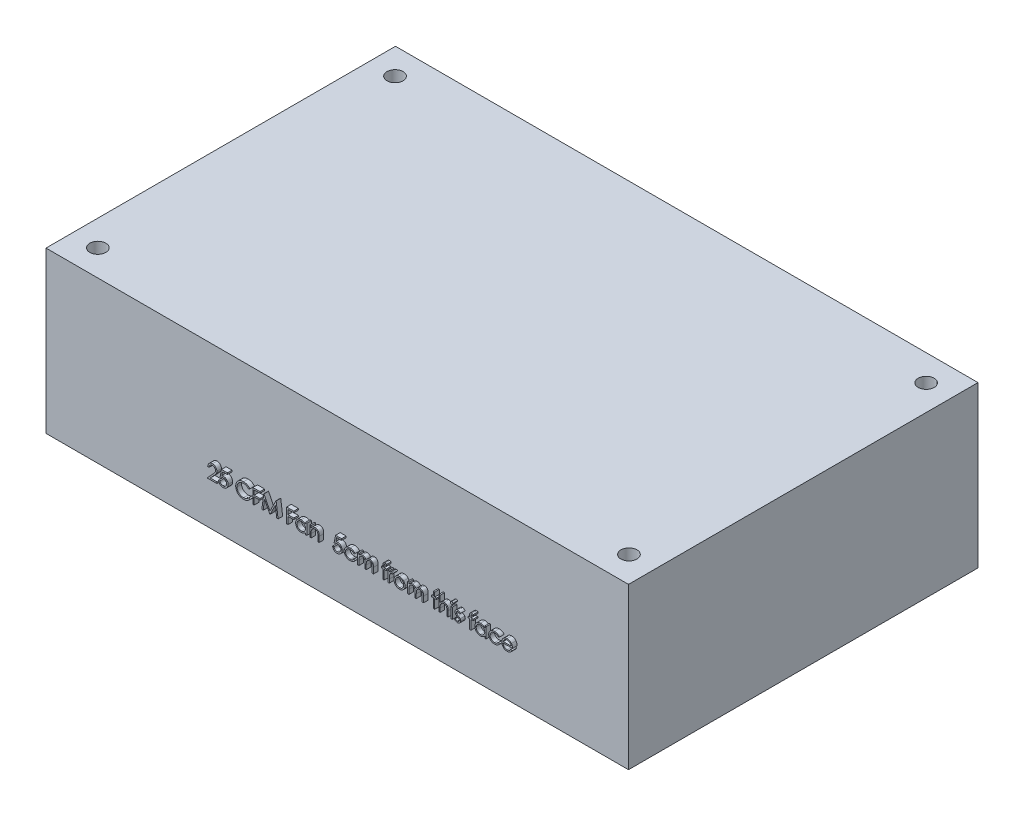
from build123d import *

# Parameters (mm, degrees)
SKETCH1_W           = 127
SKETCH1_H           = 76.2
SKETCH1_R           = 1.75
BOSS_EXTRUDE1_DEPTH = 35
SKETCH2_R           = 14.423975821
BOSS_EXTRUDE2_DEPTH = 3
SKETCH3_W           = 0.284935898
SKETCH3_H           = 2.320192308
BOSS_EXTRUDE3_DEPTH = 1


with BuildPart() as part:
    # Sketch1 → Boss-Extrude1 (new body)
    with BuildSketch(Plane(origin=(0, 0, 0), x_dir=(1, 0, 0), z_dir=(0, 1, 0))):
        Rectangle(SKETCH1_W, SKETCH1_H)
        with Locations((-57.9, 32.4)):
            Circle(SKETCH1_R, mode=Mode.SUBTRACT)
        with Locations((57.9, 32.4)):
            Circle(SKETCH1_R, mode=Mode.SUBTRACT)
        with Locations((57.9, -32.4)):
            Circle(SKETCH1_R, mode=Mode.SUBTRACT)
        with Locations((-57.9, -32.4)):
            Circle(SKETCH1_R, mode=Mode.SUBTRACT)
    extrude(amount=BOSS_EXTRUDE1_DEPTH)

    # Sketch2 → Boss-Extrude2 (add)
    with BuildSketch(Plane.XZ):
        Circle(SKETCH2_R)
    extrude(amount=BOSS_EXTRUDE2_DEPTH)

    # Sketch3 → Boss-Extrude3 (add)
    # profile 1 of 24: a face of its own
    with BuildSketch(Plane.XY.offset(38.1)):
        with BuildLine():
            Line((-27.245488354, 12.364385085), (-26.960552457, 12.364385085))
            add(Edge.make_bspline(
                [(-26.224680061, 13.097077393), (-26.273382291, 13.096642372), (-26.345600598, 13.091774547), (-26.438156543, 13.070859478), (-26.503326307, 13.049850823), (-26.565483649, 13.023123541), (-26.624324528, 12.989840001), (-26.679717305, 12.950121815), (-26.731766032, 12.905090824), (-26.779721105, 12.854955182), (-26.821855469, 12.799066186), (-26.858669386, 12.738444035), (-26.89079673, 12.673253151), (-26.916858279, 12.602898718), (-26.944191295, 12.500193447), (-26.956619078, 12.419641521), (-26.960552457, 12.364385085)],
                knots=[0, 0, 0, 0, 0.126546911, 0.186887153, 0.245877536, 0.304040885, 0.362191218, 0.420975933, 0.480660283, 0.540600275, 0.600689098, 0.66193579, 0.724442506, 0.789038394, 0.856313757, 1, 1, 1, 1], degree=3))
            add(Edge.make_bspline(
                [(-25.535872969, 12.453427553), (-25.535646022, 12.496137197), (-25.542223194, 12.559361343), (-25.562797372, 12.640768313), (-25.584491915, 12.699123848), (-25.613171166, 12.754863753), (-25.648070003, 12.808056348), (-25.688338692, 12.859481324), (-25.734921471, 12.90769899), (-25.78609482, 12.951859688), (-25.840155312, 12.99097979), (-25.897350747, 13.023670969), (-25.957440073, 13.050476548), (-26.020255329, 13.071479452), (-26.109155414, 13.091306714), (-26.178036904, 13.096900039), (-26.224680061, 13.097077393)],
                knots=[0, 0, 0, 0, 0.122121906, 0.180988497, 0.239933216, 0.299905831, 0.359988847, 0.421775742, 0.486575826, 0.551534805, 0.615017543, 0.677258617, 0.739729962, 0.803050103, 0.866495132, 1, 1, 1, 1], degree=3))
            add(Edge.make_bspline(
                [(-26.13627361, 11.480320582), (-26.078543679, 11.540283451), (-25.996217325, 11.627238732), (-25.894115717, 11.740903694), (-25.828783406, 11.815819284), (-25.772692305, 11.885335565), (-25.722914546, 11.947197803), (-25.683033621, 12.004125039), (-25.639740571, 12.070111319), (-25.597872827, 12.150675739), (-25.549703139, 12.281539853), (-25.535820862, 12.384987422), (-25.535872969, 12.453427553)],
                knots=[0, 0, 0, 0, 0.212829202, 0.30610131, 0.390647321, 0.466924469, 0.534481039, 0.593586941, 0.644557005, 0.736200453, 0.825024026, 1, 1, 1, 1], degree=3))
            Line((-26.13627361, 11.480320582), (-27.367603739, 10.166308162))
            Line((-27.367603739, 10.166308162), (-25.210231944, 10.166308162))
            Line((-25.210231944, 10.166308162), (-25.210231944, 10.491949188))
            Line((-25.210231944, 10.491949188), (-26.687700894, 10.491949188))
            Line((-26.687700894, 10.491949188), (-25.893314876, 11.339760686))
            add(Edge.make_bspline(
                [(-25.250937072, 12.478868258), (-25.250572493, 12.391178871), (-25.267547051, 12.260249195), (-25.322306641, 12.093336264), (-25.371223918, 11.992881268), (-25.420647804, 11.911933805), (-25.465174887, 11.845287183), (-25.517304366, 11.77352721), (-25.57779121, 11.696894268), (-25.645384491, 11.614787636), (-25.749763541, 11.493482367), (-25.83469877, 11.402650464), (-25.893314876, 11.339760686)],
                knots=[0, 0, 0, 0, 0.195672309, 0.292422427, 0.391342544, 0.444462441, 0.504228775, 0.570352338, 0.642545753, 0.722287505, 0.807921123, 1, 1, 1, 1], degree=3))
            add(Edge.make_bspline(
                [(-26.210051655, 13.422718419), (-26.141666832, 13.422831346), (-26.040964895, 13.414391509), (-25.911937912, 13.384982649), (-25.821870176, 13.354792793), (-25.737500271, 13.314158564), (-25.65819511, 13.265358729), (-25.583010374, 13.208915852), (-25.515331334, 13.142464341), (-25.453184836, 13.071523573), (-25.399570225, 12.995788089), (-25.353658389, 12.917565953), (-25.315382521, 12.836259829), (-25.287231177, 12.751107423), (-25.258288356, 12.632777484), (-25.251736317, 12.540548709), (-25.250937072, 12.478868258)],
                knots=[0, 0, 0, 0, 0.136516798, 0.200788824, 0.263829673, 0.325735023, 0.387290692, 0.449509219, 0.51296782, 0.576275215, 0.6375801, 0.697902606, 0.757172088, 0.816598528, 0.876653171, 1, 1, 1, 1], degree=3))
            add(Edge.make_bspline(
                [(-27.245488354, 12.364385085), (-27.24368546, 12.438683817), (-27.231763922, 12.547820329), (-27.198437305, 12.688134534), (-27.163917688, 12.785989044), (-27.120995054, 12.87909682), (-27.069535235, 12.96708977), (-27.008580162, 13.049631744), (-26.939449943, 13.125957748), (-26.864366923, 13.195977724), (-26.783353663, 13.256444189), (-26.698222915, 13.307530049), (-26.609232373, 13.350248017), (-26.515380274, 13.382273955), (-26.38303481, 13.414606563), (-26.279683508, 13.422852009), (-26.210051655, 13.422718419)],
                knots=[0, 0, 0, 0, 0.135103289, 0.198978674, 0.2619043, 0.323494969, 0.385195378, 0.446969239, 0.509764777, 0.572250569, 0.633405176, 0.693251163, 0.752583163, 0.812579266, 0.873275085, 1, 1, 1, 1], degree=3))
        make_face()
    # profile 2 of 24: a face of its own
    with BuildSketch(Plane.XY.offset(38.1)):
        with BuildLine():
            Line((-22.930744764, 13.015667137), (-22.930744764, 13.341308162))
            Line((-22.930744764, 13.341308162), (-24.233308867, 13.341308162))
            Line((-24.233308867, 13.341308162), (-24.558949892, 11.753808162))
            add(Edge.make_bspline(
                [(-23.859330501, 11.916628675), (-23.910157139, 11.916536317), (-23.988385274, 11.910937538), (-24.094604697, 11.894070122), (-24.180162457, 11.876330089), (-24.269622484, 11.853065397), (-24.397344539, 11.814915976), (-24.493688697, 11.779319613), (-24.558949892, 11.753808162)],
                knots=[0, 0, 0, 0, 0.211023342, 0.325099662, 0.446502097, 0.573787718, 0.70890071, 1, 1, 1, 1], degree=3))
            add(Edge.make_bspline(
                [(-23.093565277, 11.215737249), (-23.09379638, 11.265513506), (-23.098835433, 11.339186872), (-23.121514477, 11.433001147), (-23.144560111, 11.498417661), (-23.173846833, 11.560306438), (-23.209629047, 11.618729117), (-23.252585677, 11.672916259), (-23.301654658, 11.722893086), (-23.355410185, 11.769016584), (-23.414777024, 11.80833612), (-23.478512733, 11.84141313), (-23.545849907, 11.869962857), (-23.618388231, 11.890450321), (-23.722590931, 11.911547375), (-23.804091389, 11.916204912), (-23.859330501, 11.916628675)],
                knots=[0, 0, 0, 0, 0.127916032, 0.188360206, 0.247216077, 0.305630129, 0.36376984, 0.422660914, 0.482687294, 0.543300221, 0.604117955, 0.664964891, 0.727413494, 0.791467625, 0.858055443, 1, 1, 1, 1], degree=3))
            add(Edge.make_bspline(
                [(-23.899399612, 10.410538931), (-23.845873403, 10.410589226), (-23.766490106, 10.417848474), (-23.663931756, 10.441434229), (-23.591371495, 10.467413982), (-23.521012179, 10.499030545), (-23.454633092, 10.539591477), (-23.390314068, 10.586273622), (-23.330054229, 10.639755555), (-23.27486427, 10.698692384), (-23.22609938, 10.76171832), (-23.185481815, 10.828952799), (-23.151246058, 10.899232355), (-23.125274265, 10.973325197), (-23.100050762, 11.078386741), (-23.093976948, 11.160405254), (-23.093565277, 11.215737249)],
                knots=[0, 0, 0, 0, 0.12642469, 0.187680284, 0.248216424, 0.30830506, 0.369660991, 0.431698552, 0.495946892, 0.559758024, 0.622295408, 0.683910635, 0.745092408, 0.806740225, 0.869086618, 1, 1, 1, 1], degree=3))
            add(Edge.make_bspline(
                [(-24.599655021, 10.980410726), (-24.587454406, 10.922066386), (-24.563528273, 10.838040681), (-24.513409747, 10.737318024), (-24.470428464, 10.672391632), (-24.419123994, 10.615778623), (-24.360588129, 10.565324981), (-24.294957822, 10.519812346), (-24.222030435, 10.481860055), (-24.145090405, 10.449552971), (-24.037663502, 10.420560384), (-23.95491996, 10.409727805), (-23.899399612, 10.410538931)],
                knots=[0, 0, 0, 0, 0.181994156, 0.264376949, 0.342179862, 0.418617611, 0.496509075, 0.577369092, 0.661510592, 0.746732551, 0.831257984, 1, 1, 1, 1], degree=3))
            Line((-24.599655021, 10.980410726), (-24.884590918, 10.980410726))
            add(Edge.make_bspline(
                [(-23.91593607, 10.084897906), (-23.978230485, 10.084180097), (-24.070028489, 10.092969138), (-24.188731408, 10.118158335), (-24.272307619, 10.145912386), (-24.352472702, 10.180745031), (-24.428149102, 10.224753474), (-24.501270026, 10.274628099), (-24.568863128, 10.333483645), (-24.631597472, 10.397814371), (-24.687755996, 10.467625867), (-24.737768251, 10.541766388), (-24.780844054, 10.620594531), (-24.817556166, 10.703908589), (-24.856738073, 10.823098666), (-24.876064084, 10.916594086), (-24.884590918, 10.980410726)],
                knots=[0, 0, 0, 0, 0.128708372, 0.190236142, 0.250724402, 0.310637179, 0.370766408, 0.431614744, 0.493522974, 0.555883455, 0.617342367, 0.678668039, 0.74071136, 0.802985363, 0.86680258, 1, 1, 1, 1], degree=3))
            add(Edge.make_bspline(
                [(-22.80862938, 11.203652914), (-22.809498821, 11.152303232), (-22.812479338, 11.075638635), (-22.828265685, 10.975334957), (-22.844014064, 10.902227113), (-22.86446501, 10.830862498), (-22.889219614, 10.761038394), (-22.919514708, 10.693188983), (-22.952744564, 10.626672379), (-22.990161021, 10.562992304), (-23.031688665, 10.503439295), (-23.075563075, 10.447119982), (-23.122772046, 10.394638381), (-23.173754377, 10.346339359), (-23.227892633, 10.301936272), (-23.284754814, 10.260678217), (-23.34522064, 10.224239893), (-23.407942753, 10.190709333), (-23.47382691, 10.1632011), (-23.541373443, 10.138609684), (-23.611554285, 10.119000247), (-23.6842114, 10.103665018), (-23.785727267, 10.089460252), (-23.863404858, 10.08407632), (-23.91593607, 10.084897906)],
                knots=[0, 0, 0, 0, 0.087434124, 0.130118399, 0.172553695, 0.214554756, 0.256298092, 0.298438225, 0.340849003, 0.382715189, 0.423924045, 0.464246243, 0.504073671, 0.543861906, 0.583566725, 0.623094319, 0.663229061, 0.703551259, 0.743937895, 0.784541255, 0.825750111, 0.867757363, 0.910745164, 1, 1, 1, 1], degree=3))
            add(Edge.make_bspline(
                [(-23.807813074, 12.242269701), (-23.738123342, 12.242627018), (-23.635196217, 12.233753035), (-23.503281267, 12.202671146), (-23.410750976, 12.170847215), (-23.322884507, 12.130098374), (-23.240490961, 12.079210201), (-23.162333429, 12.019761428), (-23.089814031, 11.951412927), (-23.024024301, 11.876191122), (-22.966178784, 11.795312217), (-22.917048017, 11.709562091), (-22.877523027, 11.61812165), (-22.846003938, 11.522001135), (-22.817303805, 11.383777067), (-22.808302967, 11.276523413), (-22.80862938, 11.203652914)],
                knots=[0, 0, 0, 0, 0.129394274, 0.190894061, 0.251281069, 0.310814964, 0.370370987, 0.430768263, 0.492881251, 0.555103948, 0.616067051, 0.677256033, 0.738259805, 0.800762134, 0.864777582, 1, 1, 1, 1], degree=3))
            add(Edge.make_bspline(
                [(-24.181791439, 12.180575991), (-24.116875456, 12.198981408), (-23.993744075, 12.230705795), (-23.867036097, 12.242048487), (-23.807813074, 12.242269701)],
                knots=[0, 0, 0, 0, 0.53290146, 1, 1, 1, 1], degree=3))
            Line((-24.181791439, 12.180575991), (-24.010702697, 13.015667137))
            Line((-24.010702697, 13.015667137), (-22.930744764, 13.015667137))
        make_face()
    # profile 3 of 24: a face of its own
    with BuildSketch(Plane.XY.offset(38.1)):
        with BuildLine():
            Line((-18.29544829, 12.567910726), (-18.04612938, 12.758716015))
            add(Edge.make_bspline(
                [(-19.431375774, 13.422718419), (-19.359186238, 13.422855298), (-19.25203142, 13.417952471), (-19.111870733, 13.398884748), (-19.010624009, 13.379749042), (-18.911634107, 13.355970115), (-18.8156582, 13.325001348), (-18.722132959, 13.289589275), (-18.631648251, 13.248805628), (-18.544638294, 13.203025026), (-18.461129853, 13.152755266), (-18.381787501, 13.098057912), (-18.306048354, 13.039400805), (-18.235196367, 12.975533169), (-18.144253857, 12.885600109), (-18.084404413, 12.810175791), (-18.04612938, 12.758716015)],
                knots=[0, 0, 0, 0, 0.135682946, 0.20121499, 0.265682235, 0.329266835, 0.392395428, 0.455069762, 0.51712685, 0.578790035, 0.639739863, 0.700191504, 0.759806243, 0.819628319, 0.879354791, 1, 1, 1, 1], degree=3))
            add(Edge.make_bspline(
                [(-21.139719123, 11.772252673), (-21.139776205, 11.884558937), (-21.125540233, 12.051019311), (-21.073971825, 12.264597773), (-21.020145201, 12.415367282), (-20.951817908, 12.559721452), (-20.867433436, 12.696555904), (-20.767948587, 12.826746145), (-20.654150022, 12.948316735), (-20.52935672, 13.05947717), (-20.395717512, 13.15727376), (-20.253493955, 13.238656817), (-20.104252494, 13.306702339), (-19.946877216, 13.358943694), (-19.723199554, 13.408776839), (-19.549125893, 13.422489647), (-19.431375774, 13.422718419)],
                knots=[0, 0, 0, 0, 0.127013532, 0.18795481, 0.248013913, 0.307747682, 0.368234515, 0.429469844, 0.492743437, 0.556257769, 0.618216786, 0.679655476, 0.741245546, 0.803415265, 0.866815462, 1, 1, 1, 1], degree=3))
            add(Edge.make_bspline(
                [(-20.737119965, 10.640141295), (-20.802918539, 10.717011134), (-20.891344255, 10.840190108), (-20.984874557, 11.018312527), (-21.0415108, 11.15745221), (-21.085685, 11.302629251), (-21.127390481, 11.50714874), (-21.140035009, 11.665353029), (-21.139719123, 11.772252673)],
                knots=[0, 0, 0, 0, 0.247156016, 0.368779749, 0.490733862, 0.613613772, 0.738957576, 1, 1, 1, 1], degree=3))
            add(Edge.make_bspline(
                [(-19.427559668, 10.084897906), (-19.495110252, 10.08405592), (-19.59497234, 10.089473061), (-19.725979948, 10.103625025), (-19.820118875, 10.119239005), (-19.911854446, 10.137700807), (-20.00035587, 10.162438019), (-20.086493796, 10.190150931), (-20.169922245, 10.222721744), (-20.250712027, 10.259475817), (-20.328603096, 10.301015014), (-20.403557676, 10.346991754), (-20.476319974, 10.396386323), (-20.545787979, 10.45080893), (-20.635478984, 10.529406452), (-20.698039797, 10.594193832), (-20.737119965, 10.640141295)],
                knots=[0, 0, 0, 0, 0.137749562, 0.203916744, 0.268779862, 0.332413706, 0.39475354, 0.456180032, 0.516995649, 0.577395938, 0.637198344, 0.696999184, 0.756756194, 0.816553905, 0.876947997, 1, 1, 1, 1], degree=3))
            add(Edge.make_bspline(
                [(-18.04612938, 10.750808363), (-18.08541161, 10.698605503), (-18.147849705, 10.623604787), (-18.239348134, 10.531965033), (-18.31159187, 10.468337994), (-18.386995716, 10.408329474), (-18.466888773, 10.353626281), (-18.550227411, 10.30346978), (-18.636727463, 10.257543834), (-18.726297514, 10.216797617), (-18.818830096, 10.181914076), (-18.913926431, 10.151866869), (-19.011590703, 10.12713862), (-19.112026074, 10.107868699), (-19.250651992, 10.090346804), (-19.356383602, 10.084380709), (-19.427559668, 10.084897906)],
                knots=[0, 0, 0, 0, 0.123053062, 0.183475001, 0.243726501, 0.304278917, 0.364862921, 0.425946204, 0.48739123, 0.549220384, 0.611143589, 0.67352853, 0.736961457, 0.800785283, 0.866012596, 1, 1, 1, 1], degree=3))
            Line((-18.04612938, 10.750808363), (-18.29544829, 10.939705598))
            add(Edge.make_bspline(
                [(-19.429467721, 10.410538931), (-19.320452549, 10.410508699), (-19.15852655, 10.425883719), (-18.951793362, 10.482097951), (-18.805450998, 10.539994421), (-18.666393272, 10.615392894), (-18.487163466, 10.739047918), (-18.368664152, 10.855494331), (-18.29544829, 10.939705598)],
                knots=[0, 0, 0, 0, 0.252948636, 0.374754734, 0.495939754, 0.617180641, 0.740909469, 1, 1, 1, 1], degree=3))
            add(Edge.make_bspline(
                [(-20.854783226, 11.750628074), (-20.855205847, 11.658460848), (-20.842368062, 11.522342713), (-20.800955748, 11.34732173), (-20.755454403, 11.224512278), (-20.699271275, 11.106666998), (-20.628299573, 10.995778848), (-20.54609641, 10.890172422), (-20.451504897, 10.792343392), (-20.347722402, 10.702977624), (-20.236372529, 10.624281519), (-20.117732497, 10.558685043), (-19.99311225, 10.504083871), (-19.861552922, 10.462172105), (-19.674069519, 10.421854745), (-19.528314487, 10.4097437), (-19.429467721, 10.410538931)],
                knots=[0, 0, 0, 0, 0.126290104, 0.186726469, 0.246146432, 0.305575643, 0.365429386, 0.426326309, 0.488839906, 0.551724972, 0.613918596, 0.675483766, 0.737333897, 0.800229044, 0.864502298, 1, 1, 1, 1], degree=3))
            add(Edge.make_bspline(
                [(-19.449184267, 13.097077393), (-19.512576726, 13.097911921), (-19.606904132, 13.091109657), (-19.730657246, 13.072805978), (-19.821110531, 13.052766705), (-19.909632016, 13.02738308), (-19.996801605, 12.997063711), (-20.081356921, 12.959548356), (-20.164467755, 12.918084599), (-20.244096038, 12.871251087), (-20.319438832, 12.820166844), (-20.390221345, 12.765403446), (-20.456499572, 12.706755658), (-20.518341268, 12.644487593), (-20.575298331, 12.577935655), (-20.627173657, 12.507312611), (-20.67499557, 12.433549735), (-20.717824114, 12.356861879), (-20.753683917, 12.276965218), (-20.785436489, 12.195227887), (-20.81057151, 12.110726618), (-20.830430587, 12.024055149), (-20.849054433, 11.904157156), (-20.85555731, 11.812530584), (-20.854783226, 11.750628074)],
                knots=[0, 0, 0, 0, 0.087501875, 0.130462627, 0.172752021, 0.215403067, 0.25764983, 0.300152749, 0.34312149, 0.385925163, 0.427685727, 0.46881795, 0.5094918, 0.549883031, 0.589980023, 0.63040523, 0.670868626, 0.711383944, 0.751627258, 0.791775577, 0.832458919, 0.873319045, 0.914542956, 1, 1, 1, 1], degree=3))
            add(Edge.make_bspline(
                [(-18.29544829, 12.567910726), (-18.330147346, 12.610519045), (-18.385139629, 12.671484791), (-18.464653437, 12.745727791), (-18.526252942, 12.797664576), (-18.591352131, 12.844304103), (-18.65835352, 12.888094029), (-18.728383407, 12.927342282), (-18.825222463, 12.974941679), (-18.95190257, 13.024543318), (-19.167324032, 13.081138679), (-19.335639191, 13.097628881), (-19.449184267, 13.097077393)],
                knots=[0, 0, 0, 0, 0.125474941, 0.18712122, 0.248294346, 0.309294856, 0.369850066, 0.430973376, 0.49245599, 0.616147966, 0.740843698, 1, 1, 1, 1], degree=3))
        make_face()
    # profile 4 of 24: a face of its own
    with BuildSketch(Plane.XY.offset(38.1)):
        Polygon((-15.848052457, 13.341308162), (-17.394847328, 13.341308162), (-17.394847328, 10.166308162), (-17.109911431, 10.166308162), (-17.109911431, 11.713103034), (-15.848052457, 11.713103034), (-15.848052457, 12.03874406), (-17.109911431, 12.03874406), (-17.109911431, 13.015667137), (-15.848052457, 13.015667137), align=None)
    # profile 5 of 24: a face of its own
    with BuildSketch(Plane.XY.offset(38.1)):
        Polygon((-15.021865558, 13.341308162), (-15.441001175, 10.166308162), (-15.154157224, 10.166308162), (-14.850776816, 12.455971624), (-13.700220926, 10.166308162), (-13.635983146, 10.166308162), (-12.48987938, 12.450883483), (-12.185862953, 10.166308162), (-11.899655021, 10.166308162), (-12.321334708, 13.341308162), (-12.362675854, 13.341308162), (-13.670328098, 10.736179957), (-14.981160429, 13.341308162), align=None)
    # profile 6 of 24: a face of its own
    with BuildSketch(Plane.XY.offset(38.1)):
        Polygon((-8.480424251, 13.341308162), (-10.027219123, 13.341308162), (-10.027219123, 10.166308162), (-9.742283226, 10.166308162), (-9.742283226, 11.713103034), (-8.480424251, 11.713103034), (-8.480424251, 12.03874406), (-9.742283226, 12.03874406), (-9.742283226, 13.015667137), (-8.480424251, 13.015667137), align=None)
    # profile 7 of 24: a face of its own
    with BuildSketch(Plane.XY.offset(38.1)):
        with BuildLine():
            Line((-5.631065277, 10.166308162), (-5.631065277, 12.48650047))
            Line((-5.631065277, 12.48650047), (-5.916001175, 12.48650047))
            Line((-5.916001175, 12.48650047), (-5.916001175, 12.057188571))
            add(Edge.make_bspline(
                [(-6.854763194, 12.527205598), (-6.762059831, 12.52693439), (-6.624406952, 12.515032617), (-6.450237541, 12.466066012), (-6.328078894, 12.417205816), (-6.212747881, 12.352172004), (-6.065860587, 12.240453605), (-5.97218049, 12.134257497), (-5.916001175, 12.057188571)],
                knots=[0, 0, 0, 0, 0.254653531, 0.376014554, 0.495255252, 0.614797719, 0.738105554, 1, 1, 1, 1], degree=3))
            add(Edge.make_bspline(
                [(-8.073372969, 11.332764492), (-8.072903384, 11.41242775), (-8.063168403, 11.530913806), (-8.025072185, 11.683070707), (-7.985603336, 11.791342983), (-7.934937279, 11.895066149), (-7.873319366, 11.994311121), (-7.800729875, 12.08935195), (-7.717043959, 12.177953744), (-7.626388801, 12.259796558), (-7.529407295, 12.330925394), (-7.428511986, 12.392351965), (-7.322137316, 12.441031767), (-7.211859968, 12.480378421), (-7.05654565, 12.517280525), (-6.935873769, 12.526482041), (-6.854763194, 12.527205598)],
                knots=[0, 0, 0, 0, 0.12607881, 0.186904093, 0.247573935, 0.308003356, 0.369131898, 0.432033228, 0.496790794, 0.561610823, 0.624913866, 0.686726349, 0.748078833, 0.809582291, 0.871630743, 1, 1, 1, 1], degree=3))
            add(Edge.make_bspline(
                [(-6.863667441, 10.125603034), (-6.944429835, 10.125800882), (-7.064415, 10.136227952), (-7.218689741, 10.17329333), (-7.328702322, 10.21126413), (-7.43363369, 10.261694367), (-7.534381011, 10.322053927), (-7.630422668, 10.393937466), (-7.720294761, 10.476113532), (-7.803055002, 10.565371897), (-7.875682795, 10.660572497), (-7.936234533, 10.761303691), (-7.986881844, 10.866290352), (-8.025846392, 10.976339725), (-8.062745858, 11.131195525), (-8.073184291, 11.251569441), (-8.073372969, 11.332764492)],
                knots=[0, 0, 0, 0, 0.127433484, 0.189004127, 0.249930071, 0.310668454, 0.372328961, 0.43493911, 0.499575544, 0.564191208, 0.626735217, 0.688109334, 0.749293607, 0.810330528, 0.87190117, 1, 1, 1, 1], degree=3))
            add(Edge.make_bspline(
                [(-5.916001175, 10.567635286), (-5.976995242, 10.4955617), (-6.075430177, 10.395295677), (-6.226585205, 10.291306111), (-6.343303901, 10.229447029), (-6.465702153, 10.183070359), (-6.638107243, 10.138239717), (-6.772738906, 10.124870652), (-6.863667441, 10.125603034)],
                knots=[0, 0, 0, 0, 0.262084975, 0.386269912, 0.507164597, 0.627300236, 0.748144942, 1, 1, 1, 1], degree=3))
            Line((-5.916001175, 10.567635286), (-5.916001175, 10.166308162))
            Line((-5.916001175, 10.166308162), (-5.631065277, 10.166308162))
        make_face()
        with BuildLine():
            add(Edge.make_bspline(
                [(-6.850947088, 12.242269701), (-6.933044433, 12.241911164), (-7.055849203, 12.228289074), (-7.210993339, 12.176989802), (-7.32070646, 12.125079623), (-7.422912845, 12.0597252), (-7.514257745, 11.98069743), (-7.595480074, 11.890129829), (-7.663817365, 11.7884381), (-7.719426217, 11.679417024), (-7.771913945, 11.527818025), (-7.789483525, 11.408939589), (-7.788437072, 11.329584404)],
                knots=[0, 0, 0, 0, 0.169593435, 0.252475515, 0.336244477, 0.419504521, 0.502035907, 0.584774648, 0.669846475, 0.754184866, 0.836658238, 1, 1, 1, 1], degree=3))
            add(Edge.make_bspline(
                [(-5.916001175, 11.321316175), (-5.916179715, 11.384387598), (-5.924208681, 11.477873913), (-5.95252256, 11.597772987), (-5.981835627, 11.682538358), (-6.020389144, 11.76294311), (-6.066876068, 11.839563775), (-6.122126592, 11.91200204), (-6.185247876, 11.979260453), (-6.254340643, 12.040607101), (-6.327451376, 12.09536687), (-6.40544645, 12.140348122), (-6.487013805, 12.177588964), (-6.572296436, 12.207175465), (-6.693516109, 12.234096113), (-6.787357681, 12.243193777), (-6.850947088, 12.242269701)],
                knots=[0, 0, 0, 0, 0.129188088, 0.191218683, 0.251912818, 0.312507474, 0.373494434, 0.4351516, 0.498741474, 0.562095217, 0.624186567, 0.685475718, 0.746096815, 0.807611636, 0.869966581, 1, 1, 1, 1], degree=3))
            add(Edge.make_bspline(
                [(-6.853491158, 10.410538931), (-6.771564933, 10.410890414), (-6.648534067, 10.425063136), (-6.491749774, 10.475908293), (-6.379458483, 10.528374516), (-6.274850145, 10.593483704), (-6.18096195, 10.669686319), (-6.101575841, 10.758317824), (-6.034259837, 10.855724271), (-5.981534273, 10.962502424), (-5.929342564, 11.116163355), (-5.916438182, 11.239068003), (-5.916001175, 11.321316175)],
                knots=[0, 0, 0, 0, 0.16866354, 0.252551924, 0.338239689, 0.423102661, 0.505556051, 0.586175656, 0.66713572, 0.74849918, 0.830452399, 1, 1, 1, 1], degree=3))
            add(Edge.make_bspline(
                [(-7.788437072, 11.329584404), (-7.787758536, 11.250745778), (-7.772671474, 11.131433357), (-7.718341852, 10.980120471), (-7.66284705, 10.870121377), (-7.593264963, 10.767991321), (-7.512634548, 10.675697332), (-7.420149875, 10.596336596), (-7.317709061, 10.529881341), (-7.208299352, 10.476280607), (-7.054567221, 10.426050075), (-6.93413835, 10.410158233), (-6.853491158, 10.410538931)],
                knots=[0, 0, 0, 0, 0.162858895, 0.245483689, 0.330807139, 0.416493374, 0.499893203, 0.583048156, 0.667157852, 0.751311929, 0.833784789, 1, 1, 1, 1], degree=3))
        make_face(mode=Mode.SUBTRACT)
    # profile 8 of 24: a face of its own
    with BuildSketch(Plane.XY.offset(38.1)):
        with BuildLine():
            Line((-4.694847328, 12.48650047), (-4.979783226, 12.48650047))
            Line((-4.979783226, 12.48650047), (-4.979783226, 10.166308162))
            Line((-4.979783226, 10.166308162), (-4.694847328, 10.166308162))
            Line((-4.694847328, 10.166308162), (-4.694847328, 11.005215414))
            add(Edge.make_bspline(
                [(-4.650962112, 11.627876672), (-4.659448718, 11.593951553), (-4.668917294, 11.538184471), (-4.678326793, 11.457535417), (-4.684735019, 11.384159849), (-4.688635035, 11.301828038), (-4.694578826, 11.174683404), (-4.694422408, 11.074742034), (-4.694847328, 11.005215414)],
                knots=[0, 0, 0, 0, 0.167615077, 0.271052394, 0.389459503, 0.520842802, 0.666398759, 1, 1, 1, 1], degree=3))
            add(Edge.make_bspline(
                [(-3.861664235, 12.242269701), (-3.906998827, 12.242486644), (-3.974793047, 12.23732061), (-4.062457025, 12.218369635), (-4.126337684, 12.199460426), (-4.18757704, 12.173453813), (-4.248141753, 12.143946609), (-4.305751463, 12.107163151), (-4.361634573, 12.066168929), (-4.413625363, 12.020739873), (-4.462002197, 11.972802467), (-4.505124463, 11.921752064), (-4.544199445, 11.86841354), (-4.577905011, 11.812045822), (-4.617385259, 11.733367442), (-4.639541817, 11.670745384), (-4.650962112, 11.627876672)],
                knots=[0, 0, 0, 0, 0.126626858, 0.188984372, 0.250230194, 0.312351163, 0.374573618, 0.438147531, 0.502920413, 0.567974095, 0.630771334, 0.692934609, 0.754397534, 0.815218352, 0.876116925, 1, 1, 1, 1], degree=3))
            add(Edge.make_bspline(
                [(-3.263171647, 11.785609044), (-3.279066878, 11.85528364), (-3.315058669, 11.954727845), (-3.395128557, 12.065015967), (-3.465747884, 12.130507949), (-3.548515064, 12.181417535), (-3.679525261, 12.230606374), (-3.787594782, 12.24269074), (-3.861664235, 12.242269701)],
                knots=[0, 0, 0, 0, 0.260833163, 0.378476029, 0.493177646, 0.609280965, 0.729981038, 1, 1, 1, 1], degree=3))
            add(Edge.make_bspline(
                [(-3.229462713, 11.257714412), (-3.22991136, 11.318132892), (-3.230012388, 11.404666337), (-3.233579564, 11.514696377), (-3.237157211, 11.584908001), (-3.242416722, 11.646802042), (-3.249085792, 11.713020323), (-3.256764828, 11.758344026), (-3.263171647, 11.785609044)],
                knots=[0, 0, 0, 0, 0.342109649, 0.489825663, 0.623254428, 0.740079676, 0.841482673, 1, 1, 1, 1], degree=3))
            Line((-3.229462713, 11.257714412), (-3.229462713, 10.166308162))
            Line((-3.229462713, 10.166308162), (-2.944526816, 10.166308162))
            Line((-2.944526816, 10.166308162), (-2.944526816, 11.351209004))
            add(Edge.make_bspline(
                [(-3.81205486, 12.527205598), (-3.728256953, 12.526650631), (-3.603183598, 12.513041244), (-3.448450608, 12.456116389), (-3.342664634, 12.398823529), (-3.247298011, 12.327503135), (-3.163546501, 12.24443244), (-3.094274048, 12.148876643), (-3.047830723, 12.060228008), (-3.017236792, 11.981588855), (-2.997975841, 11.914236454), (-2.981619975, 11.839199271), (-2.967436277, 11.756704074), (-2.957855974, 11.666172857), (-2.947303391, 11.530349462), (-2.943819287, 11.42440337), (-2.944526816, 11.351209004)],
                knots=[0, 0, 0, 0, 0.15117814, 0.223487984, 0.295542644, 0.366976255, 0.437130525, 0.507043616, 0.578559734, 0.616613545, 0.658756237, 0.704491226, 0.754803115, 0.809331625, 0.868274455, 1, 1, 1, 1], degree=3))
            add(Edge.make_bspline(
                [(-4.694847328, 12.068000871), (-4.637373656, 12.142574601), (-4.545847679, 12.246824005), (-4.403136836, 12.356189891), (-4.294304598, 12.419812754), (-4.180341617, 12.467701953), (-4.021136296, 12.514501997), (-3.895919926, 12.52677358), (-3.81205486, 12.527205598)],
                knots=[0, 0, 0, 0, 0.273568781, 0.398988314, 0.519929781, 0.638110022, 0.756588901, 1, 1, 1, 1], degree=3))
            Line((-4.694847328, 12.068000871), (-4.694847328, 12.48650047))
        make_face()
    # profile 9 of 24: a face of its own
    with BuildSketch(Plane.XY.offset(38.1)):
        with BuildLine():
            Line((1.940088569, 13.015667137), (1.940088569, 13.341308162))
            Line((1.940088569, 13.341308162), (0.637524467, 13.341308162))
            Line((0.637524467, 13.341308162), (0.311883441, 11.753808162))
            add(Edge.make_bspline(
                [(1.011502832, 11.916628675), (0.960676194, 11.916536317), (0.882448059, 11.910937538), (0.776228636, 11.894070122), (0.690670876, 11.876330089), (0.601210849, 11.853065397), (0.473488794, 11.814915976), (0.377144636, 11.779319613), (0.311883441, 11.753808162)],
                knots=[0, 0, 0, 0, 0.211023342, 0.325099662, 0.446502097, 0.573787718, 0.70890071, 1, 1, 1, 1], degree=3))
            add(Edge.make_bspline(
                [(1.777268056, 11.215737249), (1.777036953, 11.265513506), (1.771997901, 11.339186872), (1.749318857, 11.433001147), (1.726273222, 11.498417661), (1.6969865, 11.560306438), (1.661204286, 11.618729117), (1.618247656, 11.672916259), (1.569178676, 11.722893086), (1.515423148, 11.769016584), (1.456056309, 11.80833612), (1.3923206, 11.84141313), (1.324983426, 11.869962857), (1.252445102, 11.890450321), (1.148242402, 11.911547375), (1.066741945, 11.916204912), (1.011502832, 11.916628675)],
                knots=[0, 0, 0, 0, 0.127916032, 0.188360206, 0.247216077, 0.305630129, 0.36376984, 0.422660914, 0.482687294, 0.543300221, 0.604117955, 0.664964891, 0.727413494, 0.791467625, 0.858055443, 1, 1, 1, 1], degree=3))
            add(Edge.make_bspline(
                [(0.971433721, 10.410538931), (1.024959931, 10.410589226), (1.104343228, 10.417848474), (1.206901577, 10.441434229), (1.279461838, 10.467413982), (1.349821154, 10.499030545), (1.416200241, 10.539591477), (1.480519266, 10.586273622), (1.540779105, 10.639755555), (1.595969064, 10.698692384), (1.644733953, 10.76171832), (1.685351518, 10.828952799), (1.719587276, 10.899232355), (1.745559068, 10.973325197), (1.770782571, 11.078386741), (1.776856385, 11.160405254), (1.777268056, 11.215737249)],
                knots=[0, 0, 0, 0, 0.12642469, 0.187680284, 0.248216424, 0.30830506, 0.369660991, 0.431698552, 0.495946892, 0.559758024, 0.622295408, 0.683910635, 0.745092408, 0.806740225, 0.869086618, 1, 1, 1, 1], degree=3))
            add(Edge.make_bspline(
                [(0.271178313, 10.980410726), (0.283378927, 10.922066386), (0.30730506, 10.838040681), (0.357423586, 10.737318024), (0.400404869, 10.672391632), (0.451709339, 10.615778623), (0.510245204, 10.565324981), (0.575875511, 10.519812346), (0.648802898, 10.481860055), (0.725742928, 10.449552971), (0.833169832, 10.420560384), (0.915913373, 10.409727805), (0.971433721, 10.410538931)],
                knots=[0, 0, 0, 0, 0.181994156, 0.264376949, 0.342179862, 0.418617611, 0.496509075, 0.577369092, 0.661510592, 0.746732551, 0.831257984, 1, 1, 1, 1], degree=3))
            Line((0.271178313, 10.980410726), (-0.013757585, 10.980410726))
            add(Edge.make_bspline(
                [(0.954897263, 10.084897906), (0.892602848, 10.084180097), (0.800804845, 10.092969138), (0.682101925, 10.118158335), (0.598525714, 10.145912386), (0.518360631, 10.180745031), (0.442684232, 10.224753474), (0.369563307, 10.274628099), (0.301970205, 10.333483645), (0.239235862, 10.397814371), (0.183077338, 10.467625867), (0.133065082, 10.541766388), (0.089989279, 10.620594531), (0.053277167, 10.703908589), (0.01409526, 10.823098666), (-0.005230751, 10.916594086), (-0.013757585, 10.980410726)],
                knots=[0, 0, 0, 0, 0.128708372, 0.190236142, 0.250724402, 0.310637179, 0.370766408, 0.431614744, 0.493522974, 0.555883455, 0.617342367, 0.678668039, 0.74071136, 0.802985363, 0.86680258, 1, 1, 1, 1], degree=3))
            add(Edge.make_bspline(
                [(2.062203954, 11.203652914), (2.061334512, 11.152303232), (2.058353996, 11.075638635), (2.042567649, 10.975334957), (2.02681927, 10.902227113), (2.006368324, 10.830862498), (1.981613719, 10.761038394), (1.951318626, 10.693188983), (1.918088769, 10.626672379), (1.880672312, 10.562992304), (1.839144669, 10.503439295), (1.795270258, 10.447119982), (1.748061287, 10.394638381), (1.697078956, 10.346339359), (1.6429407, 10.301936272), (1.586078519, 10.260678217), (1.525612693, 10.224239893), (1.462890581, 10.190709333), (1.397006423, 10.1632011), (1.32945989, 10.138609684), (1.259279048, 10.119000247), (1.186621934, 10.103665018), (1.085106066, 10.089460252), (1.007428475, 10.08407632), (0.954897263, 10.084897906)],
                knots=[0, 0, 0, 0, 0.087434124, 0.130118399, 0.172553695, 0.214554756, 0.256298092, 0.298438225, 0.340849003, 0.382715189, 0.423924045, 0.464246243, 0.504073671, 0.543861906, 0.583566725, 0.623094319, 0.663229061, 0.703551259, 0.743937895, 0.784541255, 0.825750111, 0.867757363, 0.910745164, 1, 1, 1, 1], degree=3))
            add(Edge.make_bspline(
                [(1.06302026, 12.242269701), (1.132709992, 12.242627018), (1.235637116, 12.233753035), (1.367552067, 12.202671146), (1.460082357, 12.170847215), (1.547948826, 12.130098374), (1.630342373, 12.079210201), (1.708499904, 12.019761428), (1.781019303, 11.951412927), (1.846809033, 11.876191122), (1.904654549, 11.795312217), (1.953785316, 11.709562091), (1.993310307, 11.61812165), (2.024829396, 11.522001135), (2.053529528, 11.383777067), (2.062530366, 11.276523413), (2.062203954, 11.203652914)],
                knots=[0, 0, 0, 0, 0.129394274, 0.190894061, 0.251281069, 0.310814964, 0.370370987, 0.430768263, 0.492881251, 0.555103948, 0.616067051, 0.677256033, 0.738259805, 0.800762134, 0.864777582, 1, 1, 1, 1], degree=3))
            add(Edge.make_bspline(
                [(0.689041894, 12.180575991), (0.753957877, 12.198981408), (0.877089259, 12.230705795), (1.003797237, 12.242048487), (1.06302026, 12.242269701)],
                knots=[0, 0, 0, 0, 0.53290146, 1, 1, 1, 1], degree=3))
            Line((0.689041894, 12.180575991), (0.860130636, 13.015667137))
            Line((0.860130636, 13.015667137), (1.940088569, 13.015667137))
        make_face()
    # profile 10 of 24: a face of its own
    with BuildSketch(Plane.XY.offset(38.1)):
        with BuildLine():
            Line((4.632351189, 11.835218419), (4.8708578, 11.983410526))
            add(Edge.make_bspline(
                [(3.808708361, 12.527205598), (3.884536836, 12.52744226), (3.997589334, 12.517961205), (4.145699438, 12.489458877), (4.252876537, 12.458135809), (4.355153337, 12.420149141), (4.450889823, 12.377504878), (4.53782802, 12.327977696), (4.617599592, 12.273808266), (4.690302158, 12.212683698), (4.780154912, 12.119963339), (4.837594242, 12.040426741), (4.8708578, 11.983410526)],
                knots=[0, 0, 0, 0, 0.182081405, 0.271909655, 0.362049459, 0.450066348, 0.533976474, 0.613602454, 0.690197614, 0.765412877, 0.841436551, 1, 1, 1, 1], degree=3))
            add(Edge.make_bspline(
                [(2.509960364, 11.307323787), (2.509176081, 11.361853086), (2.516140059, 11.442891455), (2.532100813, 11.549721996), (2.552048983, 11.627381933), (2.575135919, 11.704130614), (2.604593528, 11.779045394), (2.639152126, 11.852473746), (2.678387649, 11.924226695), (2.722555342, 11.993123775), (2.771433306, 12.0582146), (2.823180671, 12.120281101), (2.880218287, 12.177180513), (2.940125687, 12.231188343), (3.004597759, 12.280861786), (3.073264711, 12.32634682), (3.145095295, 12.368484558), (3.220047715, 12.406003356), (3.297668897, 12.438328237), (3.377491188, 12.465951411), (3.459642014, 12.487827935), (3.543577085, 12.506144196), (3.660034949, 12.521821114), (3.748754854, 12.527519993), (3.808708361, 12.527205598)],
                knots=[0, 0, 0, 0, 0.082135503, 0.122636035, 0.16283087, 0.203006601, 0.243526083, 0.284172936, 0.325409811, 0.366854666, 0.407550595, 0.448187374, 0.488682851, 0.529014965, 0.569842729, 0.611370238, 0.653237735, 0.695446119, 0.737751395, 0.780043361, 0.82280707, 0.865978142, 0.90959503, 1, 1, 1, 1], degree=3))
            add(Edge.make_bspline(
                [(3.785175709, 10.125603034), (3.696954255, 10.124710185), (3.566891964, 10.135837806), (3.399472593, 10.171726794), (3.281853695, 10.209384335), (3.169981969, 10.257933073), (3.063961333, 10.317217866), (2.964142968, 10.387750727), (2.871513829, 10.468270999), (2.786440921, 10.555575074), (2.71339123, 10.649781764), (2.650034947, 10.747427594), (2.599143189, 10.850669025), (2.558688179, 10.958134289), (2.521137476, 11.109907131), (2.509699846, 11.227725078), (2.509960364, 11.307323787)],
                knots=[0, 0, 0, 0, 0.136335251, 0.201095766, 0.264449955, 0.327004991, 0.389391387, 0.45197649, 0.515669983, 0.578973246, 0.640167029, 0.699739843, 0.758684985, 0.817820401, 0.876983987, 1, 1, 1, 1], degree=3))
            add(Edge.make_bspline(
                [(4.8708578, 10.661129877), (4.843333013, 10.619225041), (4.798470198, 10.558806668), (4.730367122, 10.485730175), (4.675959523, 10.434813575), (4.618730261, 10.386503421), (4.556748168, 10.343094528), (4.492005439, 10.302150989), (4.423743784, 10.265309229), (4.352668483, 10.232192919), (4.278879696, 10.203716167), (4.202697963, 10.179252214), (4.124033992, 10.159798635), (4.042731663, 10.144302854), (3.929741493, 10.130266787), (3.843422597, 10.124708122), (3.785175709, 10.125603034)],
                knots=[0, 0, 0, 0, 0.119068862, 0.178196546, 0.236956648, 0.295931988, 0.355855769, 0.416473305, 0.4777416, 0.53990299, 0.602537515, 0.665422385, 0.729765256, 0.794828771, 0.86182654, 1, 1, 1, 1], degree=3))
            Line((4.8708578, 10.661129877), (4.632351189, 10.817590214))
            add(Edge.make_bspline(
                [(3.789627832, 10.410538931), (3.872184849, 10.410587527), (3.994544908, 10.422093771), (4.150127837, 10.465571832), (4.259345835, 10.51010342), (4.362518322, 10.567775002), (4.493552738, 10.663934364), (4.580431412, 10.752163387), (4.632351189, 10.817590214)],
                knots=[0, 0, 0, 0, 0.255447312, 0.377298345, 0.498441779, 0.619372125, 0.741856502, 1, 1, 1, 1], degree=3))
            add(Edge.make_bspline(
                [(2.794896261, 11.332764492), (2.795117331, 11.252154591), (2.810894738, 11.130704921), (2.866030829, 10.977248448), (2.922261094, 10.866879463), (2.993468641, 10.764740325), (3.077077704, 10.673133122), (3.173162534, 10.593837594), (3.280869978, 10.528081868), (3.39766944, 10.475279391), (3.566326733, 10.424078368), (3.699751663, 10.410881698), (3.789627832, 10.410538931)],
                knots=[0, 0, 0, 0, 0.159965477, 0.240321361, 0.322528528, 0.405023583, 0.486596636, 0.567865474, 0.651332773, 0.736237567, 0.821529069, 1, 1, 1, 1], degree=3))
            add(Edge.make_bspline(
                [(3.787719779, 12.242269701), (3.71930568, 12.241273531), (3.617795547, 12.235304959), (3.487948684, 12.206160468), (3.396292546, 12.177918914), (3.30945987, 12.140041019), (3.227226688, 12.093950488), (3.148862682, 12.040383348), (3.076638876, 11.978325299), (3.010572775, 11.910835051), (2.953332275, 11.838487079), (2.903499407, 11.763448258), (2.864386001, 11.683845114), (2.832424068, 11.601497441), (2.803849093, 11.484686019), (2.794589127, 11.394055143), (2.794896261, 11.332764492)],
                knots=[0, 0, 0, 0, 0.136920982, 0.201969243, 0.26546155, 0.328247885, 0.390816717, 0.453550176, 0.517541982, 0.580738372, 0.641921509, 0.701596724, 0.76031288, 0.818756513, 0.87771808, 1, 1, 1, 1], degree=3))
            add(Edge.make_bspline(
                [(4.632351189, 11.835218419), (4.583104723, 11.900870623), (4.499007651, 11.989469349), (4.370037342, 12.085132966), (4.267321113, 12.142965774), (4.157196354, 12.187563438), (3.998070979, 12.230757866), (3.8726181, 12.242397515), (3.787719779, 12.242269701)],
                knots=[0, 0, 0, 0, 0.252584475, 0.373506483, 0.493364451, 0.614608597, 0.738470244, 1, 1, 1, 1], degree=3))
        make_face()
    # profile 11 of 24: a face of its own
    with BuildSketch(Plane.XY.offset(38.1)):
        with BuildLine():
            Line((5.725665492, 12.48650047), (5.440729595, 12.48650047))
            Line((5.440729595, 12.48650047), (5.440729595, 10.166308162))
            Line((5.440729595, 10.166308162), (5.725665492, 10.166308162))
            Line((5.725665492, 10.166308162), (5.725665492, 11.142595222))
            add(Edge.make_bspline(
                [(6.476166293, 12.242269701), (6.407397677, 12.242843481), (6.30404151, 12.226334492), (6.174479542, 12.174140188), (6.081991196, 12.120094738), (5.997015599, 12.053037366), (5.92262232, 11.974198561), (5.860081627, 11.884526896), (5.818596303, 11.800920883), (5.79183704, 11.726922214), (5.774061034, 11.664011017), (5.758786118, 11.594160755), (5.747429747, 11.517156162), (5.736489406, 11.433497859), (5.729057149, 11.307834037), (5.724762109, 11.210099151), (5.725665492, 11.142595222)],
                knots=[0, 0, 0, 0, 0.136870959, 0.206114357, 0.277538182, 0.349771978, 0.421250836, 0.492910757, 0.567026589, 0.606614153, 0.649703954, 0.69730315, 0.74908566, 0.804880647, 0.865485006, 1, 1, 1, 1], degree=3))
            add(Edge.make_bspline(
                [(7.028229595, 11.346120863), (7.028280591, 11.410147218), (7.027441753, 11.502042025), (7.020974561, 11.618810272), (7.015642833, 11.693940985), (7.007967617, 11.760535589), (6.999250327, 11.818950827), (6.988955487, 11.869040304), (6.971910383, 11.923979967), (6.945862271, 11.984505236), (6.903962855, 12.049040866), (6.85170479, 12.105524834), (6.790407432, 12.153755448), (6.721462954, 12.193585799), (6.617705315, 12.232854992), (6.533016136, 12.241791485), (6.476166293, 12.242269701)],
                knots=[0, 0, 0, 0, 0.158778855, 0.227738062, 0.289945653, 0.345498839, 0.393896337, 0.436373785, 0.472122274, 0.536383616, 0.599077902, 0.661948234, 0.726310542, 0.791771103, 0.858647304, 1, 1, 1, 1], degree=3))
            Line((7.028229595, 11.346120863), (7.028229595, 10.166308162))
            Line((7.028229595, 10.166308162), (7.313165492, 10.166308162))
            Line((7.313165492, 10.166308162), (7.313165492, 11.068817177))
            add(Edge.make_bspline(
                [(8.065574346, 12.242269701), (7.994329903, 12.243490776), (7.888192184, 12.226000179), (7.754889629, 12.173381746), (7.662163271, 12.116827768), (7.576867344, 12.04894394), (7.503479682, 11.968259757), (7.442853393, 11.876972459), (7.401801558, 11.792475487), (7.375866982, 11.716575292), (7.358742914, 11.650265542), (7.34542302, 11.574898713), (7.332931007, 11.490981089), (7.324778614, 11.397935782), (7.314468799, 11.256432573), (7.313600761, 11.145553083), (7.313165492, 11.068817177)],
                knots=[0, 0, 0, 0, 0.134706602, 0.201864998, 0.270788266, 0.340024294, 0.408082739, 0.476813195, 0.547346064, 0.585639795, 0.628864953, 0.677153203, 0.730802811, 0.789806616, 0.854325009, 1, 1, 1, 1], degree=3))
            add(Edge.make_bspline(
                [(8.615729595, 11.424351031), (8.615794307, 11.481382761), (8.61492297, 11.56332099), (8.608473208, 11.667579183), (8.603092602, 11.734863671), (8.595613619, 11.794960829), (8.585956388, 11.847749658), (8.575725889, 11.893645469), (8.558729675, 11.944523549), (8.531562664, 12.000648512), (8.49018106, 12.061176965), (8.438047591, 12.113862148), (8.377848952, 12.159608143), (8.309317644, 12.196758874), (8.206034975, 12.233263277), (8.122276249, 12.242633022), (8.065574346, 12.242269701)],
                knots=[0, 0, 0, 0, 0.150563303, 0.216151057, 0.275679792, 0.32870705, 0.375904435, 0.417301898, 0.452692748, 0.517265292, 0.581216568, 0.645321894, 0.712024493, 0.780130045, 0.850218226, 1, 1, 1, 1], degree=3))
            Line((8.615729595, 11.424351031), (8.615729595, 10.166308162))
            Line((8.615729595, 10.166308162), (8.900665492, 10.166308162))
            Line((8.900665492, 10.166308162), (8.900665492, 11.423078996))
            add(Edge.make_bspline(
                [(8.115183721, 12.527205598), (8.191079535, 12.526642701), (8.304486553, 12.514202381), (8.444410999, 12.461571407), (8.540089196, 12.408790257), (8.626413959, 12.342394294), (8.701449144, 12.263413622), (8.764740914, 12.172387649), (8.806087248, 12.086760854), (8.834131771, 12.01116377), (8.851423179, 11.946750927), (8.866698565, 11.875856303), (8.879384182, 11.79839513), (8.888642884, 11.714093828), (8.898190892, 11.58841391), (8.9010192, 11.490536857), (8.900665492, 11.423078996)],
                knots=[0, 0, 0, 0, 0.147965015, 0.218796999, 0.289470445, 0.359724218, 0.429707739, 0.50049652, 0.57442902, 0.613947296, 0.65715527, 0.70397277, 0.754938985, 0.809706611, 0.868832954, 1, 1, 1, 1], degree=3))
            add(Edge.make_bspline(
                [(7.264192135, 11.966874068), (7.287888887, 12.011426519), (7.326921607, 12.075290826), (7.385277067, 12.154323106), (7.430650702, 12.208765446), (7.478211128, 12.258937077), (7.528158696, 12.305017276), (7.580215124, 12.347197533), (7.652598135, 12.396485872), (7.746770052, 12.448759834), (7.905129165, 12.50965816), (8.031397548, 12.527407183), (8.115183721, 12.527205598)],
                knots=[0, 0, 0, 0, 0.141225536, 0.209115852, 0.274839653, 0.33948293, 0.402476267, 0.464941889, 0.526832641, 0.647414816, 0.765561512, 1, 1, 1, 1], degree=3))
            add(Edge.make_bspline(
                [(6.525775668, 12.527205598), (6.581165989, 12.526492263), (6.66428222, 12.519459962), (6.771132868, 12.491045968), (6.847888488, 12.461671944), (6.920206828, 12.426063249), (6.986509346, 12.384291245), (7.046038943, 12.337393984), (7.098771091, 12.283257583), (7.146172466, 12.220356109), (7.207629886, 12.117153964), (7.242830229, 12.029116126), (7.264192135, 11.966874068)],
                knots=[0, 0, 0, 0, 0.16653232, 0.248836331, 0.331246145, 0.412957109, 0.490494278, 0.566155792, 0.639987335, 0.716765488, 0.802143905, 1, 1, 1, 1], degree=3))
            add(Edge.make_bspline(
                [(6.047490412, 12.409542337), (6.121503493, 12.447759934), (6.277364764, 12.508252683), (6.443493019, 12.526574556), (6.525775668, 12.527205598)],
                knots=[0, 0, 0, 0, 0.50303512, 1, 1, 1, 1], degree=3))
            add(Edge.make_bspline(
                [(5.725665492, 12.083265294), (5.773458708, 12.151707446), (5.869966422, 12.272246386), (5.987903448, 12.372149618), (6.047490412, 12.409542337)],
                knots=[0, 0, 0, 0, 0.543394841, 1, 1, 1, 1], degree=3))
            Line((5.725665492, 12.083265294), (5.725665492, 12.48650047))
        make_face()
    # profile 12 of 24: a face of its own
    with BuildSketch(Plane.XY.offset(38.1)):
        with BuildLine():
            Line((11.750024467, 13.107253675), (11.750024467, 13.40363789))
            add(Edge.make_bspline(
                [(11.402758842, 13.463423547), (11.456238563, 13.462803478), (11.574001073, 13.451854307), (11.688193754, 13.421149503), (11.750024467, 13.40363789)],
                knots=[0, 0, 0, 0, 0.453862855, 1, 1, 1, 1], degree=3))
            add(Edge.make_bspline(
                [(10.935921902, 12.857298747), (10.9351504, 12.896785386), (10.937969368, 12.953582512), (10.941699024, 13.026579805), (10.946918475, 13.074285596), (10.952964478, 13.117688794), (10.961614468, 13.156145215), (10.96978922, 13.190690803), (10.984619689, 13.229791082), (11.006774138, 13.274104965), (11.042633714, 13.320935491), (11.085625766, 13.362939639), (11.136978309, 13.398329071), (11.194774593, 13.427717903), (11.282997118, 13.456731102), (11.354398037, 13.462598177), (11.402758842, 13.463423547)],
                knots=[0, 0, 0, 0, 0.133856433, 0.192947832, 0.247915963, 0.29664228, 0.341504354, 0.381630214, 0.416904813, 0.483173328, 0.548916672, 0.616061618, 0.68630213, 0.759645114, 0.835389552, 1, 1, 1, 1], degree=3))
            Line((10.935921902, 12.857298747), (10.935921902, 12.48650047))
            Line((10.935921902, 12.48650047), (10.610280877, 12.48650047))
            Line((10.610280877, 12.48650047), (10.610280877, 12.201564573))
            Line((10.610280877, 12.201564573), (10.935921902, 12.201564573))
            Line((10.935921902, 12.201564573), (10.935921902, 10.166308162))
            Line((10.935921902, 10.166308162), (11.2208578, 10.166308162))
            Line((11.2208578, 10.166308162), (11.222129835, 12.201564573))
            Line((11.222129835, 12.201564573), (11.709319338, 12.201564573))
            Line((11.709319338, 12.201564573), (11.709319338, 12.48650047))
            Line((11.709319338, 12.48650047), (11.222765853, 12.48650047))
            Line((11.222765853, 12.48650047), (11.222765853, 12.80832539))
            add(Edge.make_bspline(
                [(11.461272463, 13.178487649), (11.433927694, 13.177444121), (11.393539532, 13.175447776), (11.344334415, 13.159034273), (11.312672967, 13.143587946), (11.28641006, 13.124216253), (11.263925574, 13.104753355), (11.247627331, 13.08281392), (11.238778198, 13.062384696), (11.23338072, 13.043469865), (11.231756706, 13.024098497), (11.227779555, 13.000309491), (11.226667406, 12.971132469), (11.224152622, 12.937474705), (11.224381912, 12.882502679), (11.221425312, 12.839100883), (11.222765853, 12.80832539)],
                knots=[0, 0, 0, 0, 0.158723881, 0.22942429, 0.297719362, 0.360776094, 0.416987544, 0.468545574, 0.516674948, 0.54453398, 0.581509313, 0.628334039, 0.683432546, 0.749506043, 0.822818186, 1, 1, 1, 1], degree=3))
            add(Edge.make_bspline(
                [(11.750024467, 13.107253675), (11.699182655, 13.128488502), (11.605071442, 13.162776298), (11.505969973, 13.17831711), (11.461272463, 13.178487649)],
                knots=[0, 0, 0, 0, 0.553028173, 1, 1, 1, 1], degree=3))
        make_face()
    # profile 13 of 24: a face of its own
    with BuildSketch(Plane.XY.offset(38.1)):
        with BuildLine():
            Line((12.36060139, 12.48650047), (12.075665492, 12.48650047))
            Line((12.075665492, 12.48650047), (12.075665492, 10.166308162))
            Line((12.075665492, 10.166308162), (12.36060139, 10.166308162))
            Line((12.36060139, 10.166308162), (12.36060139, 10.946065774))
            add(Edge.make_bspline(
                [(12.4114828, 11.742359845), (12.400824035, 11.70184881), (12.390424592, 11.633657011), (12.379335895, 11.534107714), (12.372851487, 11.440729491), (12.366906843, 11.334942359), (12.362122318, 11.168703371), (12.360105675, 11.03766966), (12.36060139, 10.946065774)],
                knots=[0, 0, 0, 0, 0.15693815, 0.258600395, 0.37589093, 0.508166168, 0.656237809, 1, 1, 1, 1], degree=3))
            add(Edge.make_bspline(
                [(12.87259558, 12.242269701), (12.825855022, 12.242330046), (12.754300273, 12.225205292), (12.668173307, 12.173647543), (12.615400766, 12.129936902), (12.574541411, 12.087699847), (12.545385452, 12.050828493), (12.518640815, 12.009481358), (12.493084751, 11.964369982), (12.469808434, 11.914720743), (12.440007485, 11.841192419), (12.422298798, 11.782701771), (12.4114828, 11.742359845)],
                knots=[0, 0, 0, 0, 0.191338128, 0.295190617, 0.410312337, 0.471930251, 0.536425159, 0.603118728, 0.674117672, 0.749332023, 0.828283384, 1, 1, 1, 1], degree=3))
            add(Edge.make_bspline(
                [(13.018243617, 12.200928555), (12.992287504, 12.212422358), (12.94559445, 12.233518544), (12.894987531, 12.241977248), (12.87259558, 12.242269701)],
                knots=[0, 0, 0, 0, 0.560229945, 1, 1, 1, 1], degree=3))
            Line((13.018243617, 12.200928555), (13.174703954, 12.447703395))
            add(Edge.make_bspline(
                [(12.926657079, 12.527205598), (12.967457147, 12.526888624), (13.054966343, 12.511564258), (13.134480237, 12.472069153), (13.174703954, 12.447703395)],
                knots=[0, 0, 0, 0, 0.463523195, 1, 1, 1, 1], degree=3))
            add(Edge.make_bspline(
                [(12.36060139, 12.144959004), (12.399626792, 12.206385238), (12.461269146, 12.291445923), (12.557242043, 12.384601385), (12.627668861, 12.437694896), (12.700585939, 12.477391775), (12.798170283, 12.5161061), (12.875784151, 12.526852705), (12.926657079, 12.527205598)],
                knots=[0, 0, 0, 0, 0.306112383, 0.438366514, 0.560541455, 0.675317225, 0.786113634, 1, 1, 1, 1], degree=3))
            Line((12.36060139, 12.144959004), (12.36060139, 12.48650047))
        make_face()
    # profile 14 of 24: a face of its own
    with BuildSketch(Plane.XY.offset(38.1)):
        with BuildLine():
            Line((16.634639851, 12.48650047), (16.349703954, 12.48650047))
            Line((16.349703954, 12.48650047), (16.349703954, 10.166308162))
            Line((16.349703954, 10.166308162), (16.634639851, 10.166308162))
            Line((16.634639851, 10.166308162), (16.634639851, 11.142595222))
            add(Edge.make_bspline(
                [(17.385140652, 12.242269701), (17.316372036, 12.242843481), (17.213015869, 12.226334492), (17.083453901, 12.174140188), (16.990965555, 12.120094738), (16.905989958, 12.053037366), (16.831596679, 11.974198561), (16.769055985, 11.884526896), (16.727570662, 11.800920883), (16.700811399, 11.726922214), (16.683035393, 11.664011017), (16.667760477, 11.594160755), (16.656404106, 11.517156162), (16.645463765, 11.433497859), (16.638031508, 11.307834037), (16.633736468, 11.210099151), (16.634639851, 11.142595222)],
                knots=[0, 0, 0, 0, 0.136870959, 0.206114357, 0.277538182, 0.349771978, 0.421250836, 0.492910757, 0.567026589, 0.606614153, 0.649703954, 0.69730315, 0.74908566, 0.804880647, 0.865485006, 1, 1, 1, 1], degree=3))
            add(Edge.make_bspline(
                [(17.937203954, 11.346120863), (17.93725495, 11.410147218), (17.936416112, 11.502042025), (17.92994892, 11.618810272), (17.924617192, 11.693940985), (17.916941976, 11.760535589), (17.908224686, 11.818950827), (17.897929846, 11.869040304), (17.880884742, 11.923979967), (17.85483663, 11.984505236), (17.812937214, 12.049040866), (17.760679149, 12.105524834), (17.699381791, 12.153755448), (17.630437312, 12.193585799), (17.526679674, 12.232854992), (17.441990495, 12.241791485), (17.385140652, 12.242269701)],
                knots=[0, 0, 0, 0, 0.158778855, 0.227738062, 0.289945653, 0.345498839, 0.393896337, 0.436373785, 0.472122274, 0.536383616, 0.599077902, 0.661948234, 0.726310542, 0.791771103, 0.858647304, 1, 1, 1, 1], degree=3))
            Line((17.937203954, 11.346120863), (17.937203954, 10.166308162))
            Line((17.937203954, 10.166308162), (18.222139851, 10.166308162))
            Line((18.222139851, 10.166308162), (18.222139851, 11.068817177))
            add(Edge.make_bspline(
                [(18.974548705, 12.242269701), (18.903304262, 12.243490776), (18.797166543, 12.226000179), (18.663863988, 12.173381746), (18.57113763, 12.116827768), (18.485841703, 12.04894394), (18.412454041, 11.968259757), (18.351827752, 11.876972459), (18.310775917, 11.792475487), (18.284841341, 11.716575292), (18.267717272, 11.650265542), (18.254397379, 11.574898713), (18.241905366, 11.490981089), (18.233752973, 11.397935782), (18.223443158, 11.256432573), (18.22257512, 11.145553083), (18.222139851, 11.068817177)],
                knots=[0, 0, 0, 0, 0.134706602, 0.201864998, 0.270788266, 0.340024294, 0.408082739, 0.476813195, 0.547346064, 0.585639795, 0.628864953, 0.677153203, 0.730802811, 0.789806616, 0.854325009, 1, 1, 1, 1], degree=3))
            add(Edge.make_bspline(
                [(19.524703954, 11.424351031), (19.524768666, 11.481382761), (19.523897329, 11.56332099), (19.517447567, 11.667579183), (19.512066961, 11.734863671), (19.504587978, 11.794960829), (19.494930747, 11.847749658), (19.484700248, 11.893645469), (19.467704034, 11.944523549), (19.440537023, 12.000648512), (19.399155419, 12.061176965), (19.34702195, 12.113862148), (19.286823311, 12.159608143), (19.218292003, 12.196758874), (19.115009334, 12.233263277), (19.031250608, 12.242633022), (18.974548705, 12.242269701)],
                knots=[0, 0, 0, 0, 0.150563303, 0.216151057, 0.275679792, 0.32870705, 0.375904435, 0.417301898, 0.452692748, 0.517265292, 0.581216568, 0.645321894, 0.712024493, 0.780130045, 0.850218226, 1, 1, 1, 1], degree=3))
            Line((19.524703954, 11.424351031), (19.524703954, 10.166308162))
            Line((19.524703954, 10.166308162), (19.809639851, 10.166308162))
            Line((19.809639851, 10.166308162), (19.809639851, 11.423078996))
            add(Edge.make_bspline(
                [(19.02415808, 12.527205598), (19.100053894, 12.526642701), (19.213460912, 12.514202381), (19.353385358, 12.461571407), (19.449063555, 12.408790257), (19.535388318, 12.342394294), (19.610423503, 12.263413622), (19.673715273, 12.172387649), (19.715061607, 12.086760854), (19.74310613, 12.01116377), (19.760397538, 11.946750927), (19.775672924, 11.875856303), (19.788358541, 11.79839513), (19.797617243, 11.714093828), (19.807165251, 11.58841391), (19.809993559, 11.490536857), (19.809639851, 11.423078996)],
                knots=[0, 0, 0, 0, 0.147965015, 0.218796999, 0.289470445, 0.359724218, 0.429707739, 0.50049652, 0.57442902, 0.613947296, 0.65715527, 0.70397277, 0.754938985, 0.809706611, 0.868832954, 1, 1, 1, 1], degree=3))
            add(Edge.make_bspline(
                [(18.173166494, 11.966874068), (18.196863246, 12.011426519), (18.235895966, 12.075290826), (18.294251426, 12.154323106), (18.339625061, 12.208765446), (18.387185487, 12.258937077), (18.437133055, 12.305017276), (18.489189482, 12.347197533), (18.561572494, 12.396485872), (18.655744411, 12.448759834), (18.814103524, 12.50965816), (18.940371906, 12.527407183), (19.02415808, 12.527205598)],
                knots=[0, 0, 0, 0, 0.141225536, 0.209115852, 0.274839653, 0.33948293, 0.402476267, 0.464941889, 0.526832641, 0.647414816, 0.765561512, 1, 1, 1, 1], degree=3))
            add(Edge.make_bspline(
                [(17.434750027, 12.527205598), (17.490140348, 12.526492263), (17.573256579, 12.519459962), (17.680107227, 12.491045968), (17.756862847, 12.461671944), (17.829181187, 12.426063249), (17.895483705, 12.384291245), (17.955013302, 12.337393984), (18.00774545, 12.283257583), (18.055146825, 12.220356109), (18.116604245, 12.117153964), (18.151804588, 12.029116126), (18.173166494, 11.966874068)],
                knots=[0, 0, 0, 0, 0.16653232, 0.248836331, 0.331246145, 0.412957109, 0.490494278, 0.566155792, 0.639987335, 0.716765488, 0.802143905, 1, 1, 1, 1], degree=3))
            add(Edge.make_bspline(
                [(16.956464771, 12.409542337), (17.030477852, 12.447759934), (17.186339123, 12.508252683), (17.352467378, 12.526574556), (17.434750027, 12.527205598)],
                knots=[0, 0, 0, 0, 0.50303512, 1, 1, 1, 1], degree=3))
            add(Edge.make_bspline(
                [(16.634639851, 12.083265294), (16.682433067, 12.151707446), (16.778940781, 12.272246386), (16.896877807, 12.372149618), (16.956464771, 12.409542337)],
                knots=[0, 0, 0, 0, 0.543394841, 1, 1, 1, 1], degree=3))
            Line((16.634639851, 12.083265294), (16.634639851, 12.48650047))
        make_face()
    # profile 15 of 24: a face of its own
    with BuildSketch(Plane.XY.offset(38.1)):
        Polygon((22.251947543, 13.422718419), (21.967011646, 13.422718419), (21.967011646, 12.48650047), (21.559960364, 12.48650047), (21.559960364, 12.201564573), (21.967011646, 12.201564573), (21.967011646, 10.166308162), (22.251947543, 10.166308162), (22.251947543, 12.201564573), (22.658998825, 12.201564573), (22.658998825, 12.48650047), (22.251947543, 12.48650047), align=None)
    # profile 16 of 24: a face of its own
    with BuildSketch(Plane.XY.offset(38.1)):
        with BuildLine():
            Line((23.432396261, 13.422718419), (23.147460364, 13.422718419))
            Line((23.147460364, 13.422718419), (23.147460364, 10.166308162))
            Line((23.147460364, 10.166308162), (23.432396261, 10.166308162))
            Line((23.432396261, 10.166308162), (23.432396261, 11.005215414))
            add(Edge.make_bspline(
                [(23.476281478, 11.627876672), (23.467795789, 11.594381933), (23.458238601, 11.539048282), (23.448926229, 11.458806102), (23.442507287, 11.385432239), (23.43859151, 11.302888674), (23.432686437, 11.175318357), (23.432802742, 11.074954556), (23.432396261, 11.005215414)],
                knots=[0, 0, 0, 0, 0.165611346, 0.269045027, 0.387447975, 0.518826658, 0.665393555, 1, 1, 1, 1], degree=3))
            add(Edge.make_bspline(
                [(24.264943337, 12.242269701), (24.219607529, 12.242489065), (24.1518169, 12.237315882), (24.064147071, 12.218376557), (24.000282747, 12.199434824), (23.939156424, 12.173624818), (23.878987192, 12.143754004), (23.821479586, 12.107188222), (23.765612424, 12.066162118), (23.713617347, 12.020741631), (23.665241623, 11.972802008), (23.622119066, 11.921752185), (23.583044161, 11.868413509), (23.549338575, 11.812045831), (23.509858334, 11.733367436), (23.487701772, 11.670745387), (23.476281478, 11.627876672)],
                knots=[0, 0, 0, 0, 0.126693877, 0.189084395, 0.250362632, 0.312516479, 0.374242602, 0.437850162, 0.502657326, 0.567745439, 0.630575914, 0.69277209, 0.754267546, 0.815120554, 0.876051359, 1, 1, 1, 1], degree=3))
            add(Edge.make_bspline(
                [(24.86470796, 11.785609044), (24.847114314, 11.855150421), (24.810303508, 11.954400928), (24.730243188, 12.065050815), (24.659663718, 12.130303908), (24.577506917, 12.181433576), (24.446919427, 12.230783229), (24.338992259, 12.242603463), (24.264943337, 12.242269701)],
                knots=[0, 0, 0, 0, 0.26195405, 0.379637675, 0.494379033, 0.609866212, 0.729887486, 1, 1, 1, 1], degree=3))
            add(Edge.make_bspline(
                [(24.897780877, 11.257714412), (24.897371865, 11.318135956), (24.897162286, 11.404661008), (24.893749121, 11.514702956), (24.889816281, 11.584870728), (24.885656537, 11.646833405), (24.878699919, 11.713013063), (24.87115013, 11.758346759), (24.86470796, 11.785609044)],
                knots=[0, 0, 0, 0, 0.342141307, 0.489870991, 0.623312103, 0.740055623, 0.841468004, 1, 1, 1, 1], degree=3))
            Line((24.897780877, 11.257714412), (24.897780877, 10.166308162))
            Line((24.897780877, 10.166308162), (25.182716774, 10.166308162))
            Line((25.182716774, 10.166308162), (25.182716774, 11.351209004))
            add(Edge.make_bspline(
                [(24.315188729, 12.527205598), (24.398983353, 12.526647436), (24.524066208, 12.513047293), (24.678784108, 12.456107753), (24.784612015, 12.398855703), (24.879704226, 12.327475141), (24.963931904, 12.245081393), (25.032730423, 12.149581992), (25.079538195, 12.061356903), (25.109994023, 11.982853858), (25.129272652, 11.915510743), (25.145617838, 11.840470149), (25.159863177, 11.757770709), (25.16934057, 11.667015468), (25.179980661, 11.530776795), (25.183423392, 11.424613848), (25.182716774, 11.351209004)],
                knots=[0, 0, 0, 0, 0.151154907, 0.223453638, 0.295497225, 0.366919857, 0.436794085, 0.506696431, 0.577863847, 0.61591181, 0.658048026, 0.703775986, 0.754080143, 0.808979421, 0.867913193, 1, 1, 1, 1], degree=3))
            add(Edge.make_bspline(
                [(23.432396261, 12.048284324), (23.489695489, 12.124481113), (23.584651306, 12.227193059), (23.725737628, 12.342225113), (23.834886248, 12.409282955), (23.948333969, 12.462155905), (24.106882643, 12.512813972), (24.231768343, 12.527033317), (24.315188729, 12.527205598)],
                knots=[0, 0, 0, 0, 0.273995891, 0.40068416, 0.522554679, 0.641533771, 0.759969143, 1, 1, 1, 1], degree=3))
            Line((23.432396261, 12.048284324), (23.432396261, 13.422718419))
        make_face()
    # profile 17 of 24: a face of its own
    with BuildSketch(Plane.XY.offset(38.1)):
        with Locations((25.935761646, 11.326404316)):
            Rectangle(SKETCH3_W, SKETCH3_H)
    # profile 18 of 24: a face of its own
    with BuildSketch(Plane.XY.offset(38.1)):
        with BuildLine():
            Line((27.675905877, 11.998038931), (27.869255236, 12.197112449))
            add(Edge.make_bspline(
                [(27.275214771, 12.527205598), (27.325012643, 12.527157349), (27.401106289, 12.516551698), (27.498982568, 12.481653399), (27.57366651, 12.445206283), (27.647860319, 12.397942529), (27.750827099, 12.31913204), (27.823346499, 12.249086807), (27.869255236, 12.197112449)],
                knots=[0, 0, 0, 0, 0.213411613, 0.32612673, 0.444451672, 0.56906108, 0.702712204, 1, 1, 1, 1], degree=3))
            add(Edge.make_bspline(
                [(26.688806518, 11.918536728), (26.689093891, 11.960394398), (26.692838985, 12.022656027), (26.711599759, 12.102098959), (26.728872768, 12.158455249), (26.752899917, 12.211525437), (26.781606398, 12.262014602), (26.815340942, 12.309853635), (26.854205863, 12.354306503), (26.896938338, 12.394682693), (26.943107156, 12.429879059), (26.991674019, 12.45990954), (27.042844459, 12.485102884), (27.097110381, 12.504129943), (27.174378092, 12.522039775), (27.234472208, 12.527690523), (27.275214771, 12.527205598)],
                knots=[0, 0, 0, 0, 0.133043535, 0.196507438, 0.258613417, 0.319728338, 0.380872854, 0.442635602, 0.505079304, 0.56788052, 0.628813854, 0.688910091, 0.748765006, 0.809385783, 0.870884336, 1, 1, 1, 1], degree=3))
            add(Edge.make_bspline(
                [(26.795021462, 11.561094821), (26.759399077, 11.612252955), (26.706445644, 11.728275155), (26.687652838, 11.854384424), (26.688806518, 11.918536728)],
                knots=[0, 0, 0, 0, 0.492590796, 1, 1, 1, 1], degree=3))
            add(Edge.make_bspline(
                [(27.19507655, 11.244358042), (27.149180368, 11.26972818), (27.082971058, 11.307544287), (27.002171709, 11.363486766), (26.948550089, 11.402405542), (26.901258702, 11.441815057), (26.848722679, 11.492946513), (26.814016198, 11.532912379), (26.795021462, 11.561094821)],
                knots=[0, 0, 0, 0, 0.305950213, 0.443775499, 0.572824362, 0.692154156, 0.802295707, 1, 1, 1, 1], degree=3))
            add(Edge.make_bspline(
                [(27.546794298, 11.005215414), (27.531511665, 11.023600686), (27.503209312, 11.050278079), (27.459751873, 11.08483062), (27.418824188, 11.114179963), (27.37165326, 11.144647913), (27.296672296, 11.188739491), (27.237140667, 11.222172047), (27.19507655, 11.244358042)],
                knots=[0, 0, 0, 0, 0.167461676, 0.272270023, 0.389550841, 0.520801368, 0.666263293, 1, 1, 1, 1], degree=3))
            add(Edge.make_bspline(
                [(27.625024467, 10.783881279), (27.624872655, 10.823768005), (27.612180335, 10.903859864), (27.572094079, 10.974417271), (27.546794298, 11.005215414)],
                knots=[0, 0, 0, 0, 0.500453315, 1, 1, 1, 1], degree=3))
            add(Edge.make_bspline(
                [(27.215429114, 10.410538931), (27.269139417, 10.410074084), (27.348804383, 10.423941783), (27.444693465, 10.470907068), (27.50641974, 10.519910787), (27.558873605, 10.57703562), (27.609797603, 10.66259852), (27.625324962, 10.735604442), (27.625024467, 10.783881279)],
                knots=[0, 0, 0, 0, 0.261895674, 0.387836045, 0.517686206, 0.644508654, 0.764718263, 1, 1, 1, 1], degree=3))
            add(Edge.make_bspline(
                [(26.755588369, 10.654769701), (26.789742225, 10.616764865), (26.842622616, 10.563525112), (26.920501608, 10.505934334), (26.977490977, 10.470861073), (27.035751116, 10.443889615), (27.114184261, 10.418564656), (27.175101006, 10.410343726), (27.215429114, 10.410538931)],
                knots=[0, 0, 0, 0, 0.285904172, 0.417171648, 0.540500744, 0.659237718, 0.775006098, 1, 1, 1, 1], degree=3))
            Line((26.755588369, 10.654769701), (26.566691133, 10.439795742))
            add(Edge.make_bspline(
                [(27.230057519, 10.125603034), (27.166321654, 10.125119509), (27.070891287, 10.136119288), (26.947919784, 10.171241173), (26.858661467, 10.207212642), (26.774292623, 10.252749294), (26.671566984, 10.324950297), (26.605034058, 10.391173881), (26.566691133, 10.439795742)],
                knots=[0, 0, 0, 0, 0.251723961, 0.377218688, 0.504693549, 0.631458239, 0.755401067, 1, 1, 1, 1], degree=3))
            add(Edge.make_bspline(
                [(27.909960364, 10.795965614), (27.909532281, 10.750855266), (27.90454479, 10.683659081), (27.88368498, 10.597722984), (27.862752338, 10.536314884), (27.834459164, 10.478294667), (27.801306298, 10.42220044), (27.761505154, 10.369245115), (27.716065212, 10.319498325), (27.666312492, 10.274063491), (27.61323906, 10.23412713), (27.556779597, 10.200950249), (27.497337242, 10.173490506), (27.434778061, 10.15167523), (27.345885134, 10.131127088), (27.276675125, 10.125920623), (27.230057519, 10.125603034)],
                knots=[0, 0, 0, 0, 0.127199133, 0.188597338, 0.248639515, 0.309524699, 0.370036991, 0.431889244, 0.495704286, 0.559519328, 0.62137158, 0.682397107, 0.743568482, 0.805498484, 0.868639701, 1, 1, 1, 1], degree=3))
            add(Edge.make_bspline(
                [(27.801837367, 11.154679556), (27.83635799, 11.102487789), (27.894484849, 10.987597106), (27.90905231, 10.85968689), (27.909960364, 10.795965614)],
                knots=[0, 0, 0, 0, 0.495235025, 1, 1, 1, 1], degree=3))
            add(Edge.make_bspline(
                [(27.383973785, 11.480320582), (27.431798292, 11.453895376), (27.500608056, 11.414091517), (27.585593087, 11.357094813), (27.641350555, 11.316584274), (27.69026241, 11.275608404), (27.746229058, 11.224624902), (27.781730879, 11.183069811), (27.801837367, 11.154679556)],
                knots=[0, 0, 0, 0, 0.307114592, 0.446213159, 0.574876072, 0.69415211, 0.80458118, 1, 1, 1, 1], degree=3))
            add(Edge.make_bspline(
                [(27.052608601, 11.71946321), (27.067107021, 11.699765067), (27.095418086, 11.672972584), (27.136762648, 11.636520224), (27.176029732, 11.607519854), (27.220269559, 11.57703087), (27.28998051, 11.534022114), (27.344583749, 11.500832109), (27.383973785, 11.480320582)],
                knots=[0, 0, 0, 0, 0.177559821, 0.28398236, 0.402216747, 0.53356848, 0.676120994, 1, 1, 1, 1], degree=3))
            add(Edge.make_bspline(
                [(26.973742415, 11.929985045), (26.973810919, 11.89336774), (26.988040492, 11.817037256), (27.028396787, 11.750785993), (27.052608601, 11.71946321)],
                knots=[0, 0, 0, 0, 0.479403194, 1, 1, 1, 1], degree=3))
            add(Edge.make_bspline(
                [(27.275214771, 12.242269701), (27.235618187, 12.243081361), (27.176557363, 12.230296994), (27.106414675, 12.190775939), (27.060901225, 12.149136314), (27.022404708, 12.101256821), (26.984588131, 12.029725105), (26.97385444, 11.969849123), (26.973742415, 11.929985045)],
                knots=[0, 0, 0, 0, 0.245900629, 0.36916603, 0.498510841, 0.628503866, 0.751028329, 1, 1, 1, 1], degree=3))
            add(Edge.make_bspline(
                [(27.675905877, 11.998038931), (27.644321593, 12.035711691), (27.595817574, 12.088275383), (27.525221834, 12.146327674), (27.47529394, 12.181680681), (27.424982509, 12.208354809), (27.359611156, 12.233977627), (27.308611121, 12.242239977), (27.275214771, 12.242269701)],
                knots=[0, 0, 0, 0, 0.305035505, 0.441308964, 0.565963227, 0.683525114, 0.79333413, 1, 1, 1, 1], degree=3))
        make_face()
    # profile 19 of 24: a face of its own
    with BuildSketch(Plane.XY.offset(38.1)):
        with BuildLine():
            Line((30.677909082, 13.107253675), (30.677909082, 13.40363789))
            add(Edge.make_bspline(
                [(30.330643457, 13.463423547), (30.384123178, 13.462803478), (30.501885688, 13.451854307), (30.616078369, 13.421149503), (30.677909082, 13.40363789)],
                knots=[0, 0, 0, 0, 0.453862855, 1, 1, 1, 1], degree=3))
            add(Edge.make_bspline(
                [(29.863806518, 12.857298747), (29.863035016, 12.896785386), (29.865853984, 12.953582512), (29.86958364, 13.026579805), (29.87480309, 13.074285596), (29.880849093, 13.117688794), (29.889499083, 13.156145215), (29.897673835, 13.190690803), (29.912504305, 13.229791082), (29.934658754, 13.274104965), (29.970518329, 13.320935491), (30.013510381, 13.362939639), (30.064862925, 13.398329071), (30.122659208, 13.427717903), (30.210881734, 13.456731102), (30.282282653, 13.462598177), (30.330643457, 13.463423547)],
                knots=[0, 0, 0, 0, 0.133856433, 0.192947832, 0.247915963, 0.29664228, 0.341504354, 0.381630214, 0.416904813, 0.483173328, 0.548916672, 0.616061618, 0.68630213, 0.759645114, 0.835389552, 1, 1, 1, 1], degree=3))
            Line((29.863806518, 12.857298747), (29.863806518, 12.48650047))
            Line((29.863806518, 12.48650047), (29.538165492, 12.48650047))
            Line((29.538165492, 12.48650047), (29.538165492, 12.201564573))
            Line((29.538165492, 12.201564573), (29.863806518, 12.201564573))
            Line((29.863806518, 12.201564573), (29.863806518, 10.166308162))
            Line((29.863806518, 10.166308162), (30.148742415, 10.166308162))
            Line((30.148742415, 10.166308162), (30.15001445, 12.201564573))
            Line((30.15001445, 12.201564573), (30.637203954, 12.201564573))
            Line((30.637203954, 12.201564573), (30.637203954, 12.48650047))
            Line((30.637203954, 12.48650047), (30.150650468, 12.48650047))
            Line((30.150650468, 12.48650047), (30.150650468, 12.80832539))
            add(Edge.make_bspline(
                [(30.389157079, 13.178487649), (30.361812309, 13.177444121), (30.321424147, 13.175447776), (30.272219031, 13.159034273), (30.240557582, 13.143587946), (30.214294675, 13.124216253), (30.19181019, 13.104753355), (30.175511946, 13.08281392), (30.166662814, 13.062384696), (30.161265335, 13.043469865), (30.159641321, 13.024098497), (30.155664171, 13.000309491), (30.154552021, 12.971132469), (30.152037237, 12.937474705), (30.152266527, 12.882502679), (30.149309927, 12.839100883), (30.150650468, 12.80832539)],
                knots=[0, 0, 0, 0, 0.158723881, 0.22942429, 0.297719362, 0.360776094, 0.416987544, 0.468545574, 0.516674948, 0.54453398, 0.581509313, 0.628334039, 0.683432546, 0.749506043, 0.822818186, 1, 1, 1, 1], degree=3))
            add(Edge.make_bspline(
                [(30.677909082, 13.107253675), (30.62706727, 13.128488502), (30.532956058, 13.162776298), (30.433854588, 13.17831711), (30.389157079, 13.178487649)],
                knots=[0, 0, 0, 0, 0.553028173, 1, 1, 1, 1], degree=3))
        make_face()
    # profile 20 of 24: a face of its own
    with BuildSketch(Plane.XY.offset(38.1)):
        with BuildLine():
            Line((33.4458578, 10.166308162), (33.4458578, 12.48650047))
            Line((33.4458578, 12.48650047), (33.160921902, 12.48650047))
            Line((33.160921902, 12.48650047), (33.160921902, 12.057188571))
            add(Edge.make_bspline(
                [(32.222159883, 12.527205598), (32.314863246, 12.52693439), (32.452516125, 12.515032617), (32.626685536, 12.466066012), (32.748844183, 12.417205816), (32.864175196, 12.352172004), (33.01106249, 12.240453605), (33.104742587, 12.134257497), (33.160921902, 12.057188571)],
                knots=[0, 0, 0, 0, 0.254653531, 0.376014554, 0.495255252, 0.614797719, 0.738105554, 1, 1, 1, 1], degree=3))
            add(Edge.make_bspline(
                [(31.003550108, 11.332764492), (31.004019693, 11.41242775), (31.013754674, 11.530913806), (31.051850892, 11.683070707), (31.091319741, 11.791342983), (31.141985798, 11.895066149), (31.203603711, 11.994311121), (31.276193202, 12.08935195), (31.359879118, 12.177953744), (31.450534276, 12.259796558), (31.547515782, 12.330925394), (31.64841109, 12.392351965), (31.754785761, 12.441031767), (31.865063109, 12.480378421), (32.020377427, 12.517280525), (32.141049308, 12.526482041), (32.222159883, 12.527205598)],
                knots=[0, 0, 0, 0, 0.12607881, 0.186904093, 0.247573935, 0.308003356, 0.369131898, 0.432033228, 0.496790794, 0.561610823, 0.624913866, 0.686726349, 0.748078833, 0.809582291, 0.871630743, 1, 1, 1, 1], degree=3))
            add(Edge.make_bspline(
                [(32.213255636, 10.125603034), (32.132493242, 10.125800882), (32.012508077, 10.136227952), (31.858233335, 10.17329333), (31.748220755, 10.21126413), (31.643289387, 10.261694367), (31.542542066, 10.322053927), (31.446500409, 10.393937466), (31.356628316, 10.476113532), (31.273868075, 10.565371897), (31.201240282, 10.660572497), (31.140688544, 10.761303691), (31.090041233, 10.866290352), (31.051076685, 10.976339725), (31.014177219, 11.131195525), (31.003738786, 11.251569441), (31.003550108, 11.332764492)],
                knots=[0, 0, 0, 0, 0.127433484, 0.189004127, 0.249930071, 0.310668454, 0.372328961, 0.43493911, 0.499575544, 0.564191208, 0.626735217, 0.688109334, 0.749293607, 0.810330528, 0.87190117, 1, 1, 1, 1], degree=3))
            add(Edge.make_bspline(
                [(33.160921902, 10.567635286), (33.099927834, 10.4955617), (33.0014929, 10.395295677), (32.850337872, 10.291306111), (32.733619176, 10.229447029), (32.611220924, 10.183070359), (32.438815834, 10.138239717), (32.304184171, 10.124870652), (32.213255636, 10.125603034)],
                knots=[0, 0, 0, 0, 0.262084975, 0.386269912, 0.507164597, 0.627300236, 0.748144942, 1, 1, 1, 1], degree=3))
            Line((33.160921902, 10.567635286), (33.160921902, 10.166308162))
            Line((33.160921902, 10.166308162), (33.4458578, 10.166308162))
        make_face()
        with BuildLine():
            add(Edge.make_bspline(
                [(32.225975989, 12.242269701), (32.143878644, 12.241911164), (32.021073874, 12.228289074), (31.865929738, 12.176989802), (31.756216617, 12.125079623), (31.654010232, 12.0597252), (31.562665332, 11.98069743), (31.481443003, 11.890129829), (31.413105712, 11.7884381), (31.35749686, 11.679417024), (31.305009132, 11.527818025), (31.287439552, 11.408939589), (31.288486005, 11.329584404)],
                knots=[0, 0, 0, 0, 0.169593435, 0.252475515, 0.336244477, 0.419504521, 0.502035907, 0.584774648, 0.669846475, 0.754184866, 0.836658238, 1, 1, 1, 1], degree=3))
            add(Edge.make_bspline(
                [(33.160921902, 11.321316175), (33.160743362, 11.384387598), (33.152714396, 11.477873913), (33.124400517, 11.597772987), (33.09508745, 11.682538358), (33.056533933, 11.76294311), (33.010047009, 11.839563775), (32.954796485, 11.91200204), (32.891675201, 11.979260453), (32.822582434, 12.040607101), (32.749471701, 12.09536687), (32.671476626, 12.140348122), (32.589909272, 12.177588964), (32.50462664, 12.207175465), (32.383406968, 12.234096113), (32.289565396, 12.243193777), (32.225975989, 12.242269701)],
                knots=[0, 0, 0, 0, 0.129188088, 0.191218683, 0.251912818, 0.312507474, 0.373494434, 0.4351516, 0.498741474, 0.562095217, 0.624186567, 0.685475718, 0.746096815, 0.807611636, 0.869966581, 1, 1, 1, 1], degree=3))
            add(Edge.make_bspline(
                [(32.223431918, 10.410538931), (32.305358144, 10.410890414), (32.42838901, 10.425063136), (32.585173303, 10.475908293), (32.697464594, 10.528374516), (32.802072932, 10.593483704), (32.895961127, 10.669686319), (32.975347236, 10.758317824), (33.04266324, 10.855724271), (33.095388804, 10.962502424), (33.147580513, 11.116163355), (33.160484895, 11.239068003), (33.160921902, 11.321316175)],
                knots=[0, 0, 0, 0, 0.16866354, 0.252551924, 0.338239689, 0.423102661, 0.505556051, 0.586175656, 0.66713572, 0.74849918, 0.830452399, 1, 1, 1, 1], degree=3))
            add(Edge.make_bspline(
                [(31.288486005, 11.329584404), (31.289164541, 11.250745778), (31.304251603, 11.131433357), (31.358581225, 10.980120471), (31.414076027, 10.870121377), (31.483658114, 10.767991321), (31.564288529, 10.675697332), (31.656773202, 10.596336596), (31.759214016, 10.529881341), (31.868623725, 10.476280607), (32.022355856, 10.426050075), (32.142784727, 10.410158233), (32.223431918, 10.410538931)],
                knots=[0, 0, 0, 0, 0.162858895, 0.245483689, 0.330807139, 0.416493374, 0.499893203, 0.583048156, 0.667157852, 0.751311929, 0.833784789, 1, 1, 1, 1], degree=3))
        make_face(mode=Mode.SUBTRACT)
    # profile 21 of 24: a face of its own
    with BuildSketch(Plane.XY.offset(38.1)):
        with BuildLine():
            Line((36.13812042, 11.835218419), (36.376627031, 11.983410526))
            add(Edge.make_bspline(
                [(35.314477592, 12.527205598), (35.390306066, 12.52744226), (35.503358565, 12.517961205), (35.651468668, 12.489458877), (35.758645768, 12.458135809), (35.860922568, 12.420149141), (35.956659054, 12.377504878), (36.043597251, 12.327977696), (36.123368822, 12.273808266), (36.196071389, 12.212683698), (36.285924143, 12.119963339), (36.343363473, 12.040426741), (36.376627031, 11.983410526)],
                knots=[0, 0, 0, 0, 0.182081405, 0.271909655, 0.362049459, 0.450066348, 0.533976474, 0.613602454, 0.690197614, 0.765412877, 0.841436551, 1, 1, 1, 1], degree=3))
            add(Edge.make_bspline(
                [(34.015729595, 11.307323787), (34.014945312, 11.361853086), (34.02190929, 11.442891455), (34.037870044, 11.549721996), (34.057818213, 11.627381933), (34.08090515, 11.704130614), (34.110362759, 11.779045394), (34.144921357, 11.852473746), (34.184156879, 11.924226695), (34.228324573, 11.993123775), (34.277202537, 12.0582146), (34.328949902, 12.120281101), (34.385987517, 12.177180513), (34.445894918, 12.231188343), (34.51036699, 12.280861786), (34.579033941, 12.32634682), (34.650864526, 12.368484558), (34.725816946, 12.406003356), (34.803438128, 12.438328237), (34.883260419, 12.465951411), (34.965411245, 12.487827935), (35.049346316, 12.506144196), (35.165804179, 12.521821114), (35.254524084, 12.527519993), (35.314477592, 12.527205598)],
                knots=[0, 0, 0, 0, 0.082135503, 0.122636035, 0.16283087, 0.203006601, 0.243526083, 0.284172936, 0.325409811, 0.366854666, 0.407550595, 0.448187374, 0.488682851, 0.529014965, 0.569842729, 0.611370238, 0.653237735, 0.695446119, 0.737751395, 0.780043361, 0.82280707, 0.865978142, 0.90959503, 1, 1, 1, 1], degree=3))
            add(Edge.make_bspline(
                [(35.290944939, 10.125603034), (35.202723486, 10.124710185), (35.072661195, 10.135837806), (34.905241824, 10.171726794), (34.787622925, 10.209384335), (34.6757512, 10.257933073), (34.569730563, 10.317217866), (34.469912199, 10.387750727), (34.37728306, 10.468270999), (34.292210152, 10.555575074), (34.21916046, 10.649781764), (34.155804178, 10.747427594), (34.10491242, 10.850669025), (34.064457409, 10.958134289), (34.026906707, 11.109907131), (34.015469077, 11.227725078), (34.015729595, 11.307323787)],
                knots=[0, 0, 0, 0, 0.136335251, 0.201095766, 0.264449955, 0.327004991, 0.389391387, 0.45197649, 0.515669983, 0.578973246, 0.640167029, 0.699739843, 0.758684985, 0.817820401, 0.876983987, 1, 1, 1, 1], degree=3))
            add(Edge.make_bspline(
                [(36.376627031, 10.661129877), (36.349102244, 10.619225041), (36.304239429, 10.558806668), (36.236136352, 10.485730175), (36.181728754, 10.434813575), (36.124499492, 10.386503421), (36.062517398, 10.343094528), (35.99777467, 10.302150989), (35.929513015, 10.265309229), (35.858437714, 10.232192919), (35.784648927, 10.203716167), (35.708467194, 10.179252214), (35.629803222, 10.159798635), (35.548500893, 10.144302854), (35.435510724, 10.130266787), (35.349191827, 10.124708122), (35.290944939, 10.125603034)],
                knots=[0, 0, 0, 0, 0.119068862, 0.178196546, 0.236956648, 0.295931988, 0.355855769, 0.416473305, 0.4777416, 0.53990299, 0.602537515, 0.665422385, 0.729765256, 0.794828771, 0.86182654, 1, 1, 1, 1], degree=3))
            Line((36.376627031, 10.661129877), (36.13812042, 10.817590214))
            add(Edge.make_bspline(
                [(35.295397063, 10.410538931), (35.37795408, 10.410587527), (35.500314139, 10.422093771), (35.655897068, 10.465571832), (35.765115066, 10.51010342), (35.868287553, 10.567775002), (35.999321969, 10.663934364), (36.086200643, 10.752163387), (36.13812042, 10.817590214)],
                knots=[0, 0, 0, 0, 0.255447312, 0.377298345, 0.498441779, 0.619372125, 0.741856502, 1, 1, 1, 1], degree=3))
            add(Edge.make_bspline(
                [(34.300665492, 11.332764492), (34.300886561, 11.252154591), (34.316663969, 11.130704921), (34.37180006, 10.977248448), (34.428030325, 10.866879463), (34.499237872, 10.764740325), (34.582846934, 10.673133122), (34.678931765, 10.593837594), (34.786639209, 10.528081868), (34.90343867, 10.475279391), (35.072095964, 10.424078368), (35.205520893, 10.410881698), (35.295397063, 10.410538931)],
                knots=[0, 0, 0, 0, 0.159965477, 0.240321361, 0.322528528, 0.405023583, 0.486596636, 0.567865474, 0.651332773, 0.736237567, 0.821529069, 1, 1, 1, 1], degree=3))
            add(Edge.make_bspline(
                [(35.29348901, 12.242269701), (35.225074911, 12.241273531), (35.123564778, 12.235304959), (34.993717915, 12.206160468), (34.902061777, 12.177918914), (34.815229101, 12.140041019), (34.732995919, 12.093950488), (34.654631912, 12.040383348), (34.582408107, 11.978325299), (34.516342006, 11.910835051), (34.459101505, 11.838487079), (34.409268638, 11.763448258), (34.370155232, 11.683845114), (34.338193299, 11.601497441), (34.309618324, 11.484686019), (34.300358358, 11.394055143), (34.300665492, 11.332764492)],
                knots=[0, 0, 0, 0, 0.136920982, 0.201969243, 0.26546155, 0.328247885, 0.390816717, 0.453550176, 0.517541982, 0.580738372, 0.641921509, 0.701596724, 0.76031288, 0.818756513, 0.87771808, 1, 1, 1, 1], degree=3))
            add(Edge.make_bspline(
                [(36.13812042, 11.835218419), (36.088873954, 11.900870623), (36.004776882, 11.989469349), (35.875806573, 12.085132966), (35.773090344, 12.142965774), (35.662965584, 12.187563438), (35.50384021, 12.230757866), (35.37838733, 12.242397515), (35.29348901, 12.242269701)],
                knots=[0, 0, 0, 0, 0.252584475, 0.373506483, 0.493364451, 0.614608597, 0.738470244, 1, 1, 1, 1], degree=3))
        make_face()
    # profile 22 of 24: a face of its own
    with BuildSketch(Plane.XY.offset(38.1)):
        with BuildLine():
            Line((39.10387062, 10.766072786), (38.850735604, 10.89900047))
            add(Edge.make_bspline(
                [(37.99656393, 10.410538931), (38.052982685, 10.410266035), (38.137615696, 10.416909098), (38.248149505, 10.440059004), (38.329121751, 10.463516155), (38.406746702, 10.492168472), (38.478634052, 10.52673108), (38.544745666, 10.564968187), (38.606541706, 10.60869824), (38.66646016, 10.662239014), (38.751276012, 10.757324759), (38.812159603, 10.838632395), (38.850735604, 10.89900047)],
                knots=[0, 0, 0, 0, 0.163878894, 0.24565874, 0.327725695, 0.408609961, 0.485749086, 0.559169056, 0.630268476, 0.705306028, 0.792064966, 1, 1, 1, 1], degree=3))
            add(Edge.make_bspline(
                [(37.150024467, 11.265346624), (37.151647095, 11.205252028), (37.159702838, 11.116482422), (37.187171605, 11.00289608), (37.215515978, 10.923899739), (37.249872121, 10.848670158), (37.291949123, 10.777766051), (37.342150403, 10.711510218), (37.398144321, 10.649309985), (37.460471503, 10.593919323), (37.526042264, 10.54434173), (37.595795746, 10.502791798), (37.669181746, 10.469055825), (37.74608231, 10.44268421), (37.854923183, 10.418131064), (37.939403811, 10.410221718), (37.99656393, 10.410538931)],
                knots=[0, 0, 0, 0, 0.134475588, 0.198391058, 0.260753477, 0.321829223, 0.383037238, 0.444653123, 0.507398011, 0.569825238, 0.630777641, 0.690928687, 0.750945133, 0.811049477, 0.872330853, 1, 1, 1, 1], degree=3))
            Line((37.150024467, 11.265346624), (39.225986005, 11.265346624))
            add(Edge.make_bspline(
                [(38.973487007, 12.070544941), (39.015112755, 12.017124366), (39.069458813, 11.930365982), (39.127162867, 11.806281519), (39.161976087, 11.707510232), (39.190106707, 11.604253471), (39.217866625, 11.456973278), (39.224544133, 11.342689299), (39.225986005, 11.265346624)],
                knots=[0, 0, 0, 0, 0.236254763, 0.356174434, 0.477249655, 0.601539871, 0.729618382, 1, 1, 1, 1], degree=3))
            add(Edge.make_bspline(
                [(38.039177111, 12.527205598), (38.132456345, 12.52759746), (38.270258838, 12.514098988), (38.44496826, 12.465758025), (38.566384202, 12.415787488), (38.680384402, 12.351188261), (38.823962597, 12.243174048), (38.917800098, 12.143715186), (38.973487007, 12.070544941)],
                knots=[0, 0, 0, 0, 0.259032841, 0.381879824, 0.502258444, 0.62275219, 0.744742632, 1, 1, 1, 1], degree=3))
            add(Edge.make_bspline(
                [(37.132215973, 12.094713611), (37.187164392, 12.163406595), (37.276761055, 12.259456546), (37.417061722, 12.359933981), (37.52734945, 12.421655568), (37.645587751, 12.468493649), (37.814811646, 12.516113571), (37.948956119, 12.526118315), (38.039177111, 12.527205598)],
                knots=[0, 0, 0, 0, 0.253589335, 0.374643257, 0.495340042, 0.616324775, 0.739759335, 1, 1, 1, 1], degree=3))
            add(Edge.make_bspline(
                [(36.865088569, 11.32004414), (36.865953338, 11.390614141), (36.872553782, 11.495959607), (36.901244333, 11.632524259), (36.930406647, 11.731300951), (36.968124832, 11.827041035), (37.029967279, 11.951783189), (37.089080185, 12.038931742), (37.132215973, 12.094713611)],
                knots=[0, 0, 0, 0, 0.2537679, 0.377428427, 0.500550841, 0.623295883, 0.746578332, 1, 1, 1, 1], degree=3))
            add(Edge.make_bspline(
                [(38.032180917, 10.125603034), (37.945303229, 10.125638306), (37.817467119, 10.135613506), (37.654878233, 10.174753414), (37.543109114, 10.214600275), (37.439021113, 10.266704408), (37.342409723, 10.330165173), (37.252766279, 10.404671533), (37.172915713, 10.49086484), (37.10103034, 10.583104943), (37.037597088, 10.679222082), (36.984569818, 10.778974337), (36.941425577, 10.881727255), (36.90661361, 10.986830982), (36.873882731, 11.132379463), (36.865918357, 11.244730745), (36.865088569, 11.32004414)],
                knots=[0, 0, 0, 0, 0.139629225, 0.204796697, 0.268134963, 0.329813747, 0.391301398, 0.453433515, 0.51655169, 0.579631271, 0.641118921, 0.701294047, 0.760810336, 0.819931722, 0.878919575, 1, 1, 1, 1], degree=3))
            add(Edge.make_bspline(
                [(39.10387062, 10.766072786), (39.066223433, 10.695594467), (39.00320332, 10.596719628), (38.906188125, 10.479006816), (38.829014768, 10.404851137), (38.747664368, 10.340219976), (38.661730193, 10.283669128), (38.570753456, 10.235485254), (38.474732551, 10.194880912), (38.372861634, 10.163694942), (38.225556808, 10.133463773), (38.110461714, 10.125613158), (38.032180917, 10.125603034)],
                knots=[0, 0, 0, 0, 0.181660766, 0.265874227, 0.346354784, 0.424599862, 0.501903184, 0.579992091, 0.658443431, 0.738672236, 0.821894148, 1, 1, 1, 1], degree=3))
        make_face()
        with BuildLine():
            Line((38.941050108, 11.550282521), (37.179917295, 11.550282521))
            add(Edge.make_bspline(
                [(37.455948946, 12.024751672), (37.424307186, 11.998097534), (37.381484261, 11.951940137), (37.330022505, 11.884104657), (37.294314908, 11.826939504), (37.261604895, 11.764680843), (37.219678357, 11.673404269), (37.194825468, 11.600476407), (37.179917295, 11.550282521)],
                knots=[0, 0, 0, 0, 0.222580497, 0.338499871, 0.458708565, 0.585535346, 0.717517743, 1, 1, 1, 1], degree=3))
            add(Edge.make_bspline(
                [(38.053805516, 12.242269701), (37.99763037, 12.242407711), (37.914142482, 12.236332844), (37.80678923, 12.212994193), (37.72994713, 12.189466839), (37.656823883, 12.158055594), (37.561555717, 12.108692886), (37.497239249, 12.059487092), (37.455948946, 12.024751672)],
                knots=[0, 0, 0, 0, 0.259141276, 0.384161763, 0.505991952, 0.629098089, 0.750669123, 1, 1, 1, 1], degree=3))
            add(Edge.make_bspline(
                [(38.941050108, 11.550282521), (38.923021733, 11.623526156), (38.887084927, 11.726869017), (38.821343026, 11.851065886), (38.765475987, 11.92870693), (38.702132004, 11.997650661), (38.62897765, 12.057903325), (38.546938588, 12.111799543), (38.45644352, 12.157309859), (38.360609217, 12.19597908), (38.226526717, 12.230963882), (38.123149698, 12.243304748), (38.053805516, 12.242269701)],
                knots=[0, 0, 0, 0, 0.185231261, 0.267500523, 0.344400382, 0.419594869, 0.496890627, 0.576637919, 0.660267852, 0.745386615, 0.830040327, 1, 1, 1, 1], degree=3))
        make_face(mode=Mode.SUBTRACT)
    # profile 23 of 24: a face of its own
    with BuildSketch(Plane.XY.offset(38.1)):
        with BuildLine():
            add(Edge.make_bspline(
                [(14.580302912, 12.527205598), (14.66565613, 12.528089736), (14.791954158, 12.515783725), (14.953539096, 12.475285266), (15.06765396, 12.434277045), (15.175041209, 12.379187881), (15.313257121, 12.290699423), (15.40543672, 12.20658721), (15.461823345, 12.144959004)],
                knots=[0, 0, 0, 0, 0.258332351, 0.382133976, 0.503804392, 0.624692987, 0.74687059, 1, 1, 1, 1], degree=3))
            add(Edge.make_bspline(
                [(13.696238409, 12.143050951), (13.752135362, 12.205503035), (13.845136073, 12.288816046), (13.983023807, 12.379095277), (14.091591878, 12.433098739), (14.20561491, 12.475527307), (14.367856159, 12.515755581), (14.494516855, 12.527988785), (14.580302912, 12.527205598)],
                knots=[0, 0, 0, 0, 0.252712986, 0.374819133, 0.496436426, 0.617910557, 0.741287617, 1, 1, 1, 1], degree=3))
            add(Edge.make_bspline(
                [(13.378229595, 11.32004414), (13.378677965, 11.396885306), (13.387339017, 11.511178334), (13.420914991, 11.658598925), (13.456012998, 11.763764628), (13.500960431, 11.865121265), (13.574579858, 11.996432867), (13.645063487, 12.086344636), (13.696238409, 12.143050951)],
                knots=[0, 0, 0, 0, 0.255237725, 0.378678596, 0.501087887, 0.622713679, 0.746240795, 1, 1, 1, 1], degree=3))
            add(Edge.make_bspline(
                [(14.580302912, 10.125603034), (14.495570674, 10.125985932), (14.370368309, 10.135507388), (14.210240833, 10.17357054), (14.098456344, 10.213331021), (13.992188851, 10.263499931), (13.892596912, 10.325738167), (13.798979836, 10.39881838), (13.712735904, 10.48239866), (13.634723133, 10.573122025), (13.565894573, 10.668508118), (13.507940192, 10.767758712), (13.460431857, 10.871066553), (13.423436186, 10.977981342), (13.388391808, 11.127105459), (13.377769757, 11.242422269), (13.378229595, 11.32004414)],
                knots=[0, 0, 0, 0, 0.134635192, 0.198324187, 0.260825013, 0.322713588, 0.384554535, 0.446912858, 0.510957633, 0.574930701, 0.636684538, 0.697483115, 0.757133808, 0.816965664, 0.876818352, 1, 1, 1, 1], degree=3))
            add(Edge.make_bspline(
                [(15.779832159, 11.32004414), (15.780291998, 11.242422266), (15.769669942, 11.127105464), (15.734625573, 10.977981335), (15.697629879, 10.87106658), (15.650121629, 10.76775861), (15.59216692, 10.668508509), (15.523339623, 10.573120517), (15.445321961, 10.482404514), (15.35909627, 10.398796774), (15.265555185, 10.325926895), (15.166536971, 10.263498372), (15.06072444, 10.213200523), (14.949085973, 10.173584259), (14.78937879, 10.135618662), (14.664621885, 10.125933203), (14.580302912, 10.125603034)],
                knots=[0, 0, 0, 0, 0.123336979, 0.18326514, 0.243172443, 0.302898354, 0.363773598, 0.425605305, 0.489659043, 0.553784577, 0.616221533, 0.677854471, 0.739516897, 0.802096536, 0.865865841, 1, 1, 1, 1], degree=3))
            add(Edge.make_bspline(
                [(15.461823345, 12.144959004), (15.513558618, 12.088409604), (15.582858947, 11.997751162), (15.657461831, 11.866795302), (15.702006242, 11.764997086), (15.73706021, 11.65942271), (15.770798651, 11.511613488), (15.77940182, 11.397093994), (15.779832159, 11.32004414)],
                knots=[0, 0, 0, 0, 0.253834363, 0.376505623, 0.498533686, 0.621367729, 0.744564745, 1, 1, 1, 1], degree=3))
        make_face()
        with BuildLine():
            add(Edge.make_bspline(
                [(14.579030877, 12.242269701), (14.518268347, 12.242107607), (14.427962943, 12.23390303), (14.311880262, 12.205687217), (14.228930655, 12.176141627), (14.149434768, 12.137943551), (14.073316972, 12.091038956), (14.000353264, 12.036035574), (13.93197092, 11.973023182), (13.869212848, 11.90419005), (13.814350077, 11.830849039), (13.767702353, 11.754189752), (13.728832136, 11.674132226), (13.699918132, 11.589866153), (13.671397562, 11.471764706), (13.663335923, 11.379936573), (13.663165492, 11.318136087)],
                knots=[0, 0, 0, 0, 0.126043628, 0.187165358, 0.24739929, 0.308380031, 0.369779617, 0.432583925, 0.497640786, 0.562401137, 0.625557103, 0.687332005, 0.748312746, 0.809791039, 0.871767572, 1, 1, 1, 1], degree=3))
            add(Edge.make_bspline(
                [(15.494896261, 11.318136087), (15.494730315, 11.379939386), (15.486655586, 11.471759308), (15.458156024, 11.589873931), (15.429183649, 11.674103394), (15.390482265, 11.754397031), (15.342934954, 11.830623959), (15.2882962, 11.904444112), (15.224780837, 11.97280067), (15.156469875, 12.036060147), (15.083476584, 12.091060251), (15.0074717, 12.137737527), (14.928206612, 12.176467802), (14.845246932, 12.205419691), (14.729527833, 12.234098057), (14.639547572, 12.24195178), (14.579030877, 12.242269701)],
                knots=[0, 0, 0, 0, 0.128273727, 0.19027022, 0.251768314, 0.312768695, 0.374793279, 0.437969586, 0.5030474, 0.568125214, 0.630949749, 0.692369109, 0.752973168, 0.813641067, 0.874355209, 1, 1, 1, 1], degree=3))
            add(Edge.make_bspline(
                [(14.579030877, 10.410538931), (14.660007155, 10.409728569), (14.780289342, 10.424582099), (14.932703436, 10.473834736), (15.039956081, 10.52450015), (15.139348406, 10.588935629), (15.229473305, 10.665526984), (15.307255516, 10.755710633), (15.373794995, 10.856002313), (15.427754497, 10.964208309), (15.480421338, 11.116802972), (15.494754844, 11.237652959), (15.494896261, 11.318136087)],
                knots=[0, 0, 0, 0, 0.168983264, 0.250907582, 0.333708096, 0.416004984, 0.497659568, 0.579893286, 0.663902321, 0.748466254, 0.831790886, 1, 1, 1, 1], degree=3))
            add(Edge.make_bspline(
                [(13.663165492, 11.318136087), (13.663364447, 11.237679787), (13.677527182, 11.116750174), (13.730445451, 10.96437615), (13.783535765, 10.855869435), (13.850140838, 10.75547354), (13.928592984, 10.66596332), (14.018074359, 10.588692228), (14.117511787, 10.524557059), (14.224876569, 10.473678099), (14.377638779, 10.42480771), (14.498019274, 10.409624914), (14.579030877, 10.410538931)],
                knots=[0, 0, 0, 0, 0.168178654, 0.251488198, 0.335840671, 0.419834494, 0.502344876, 0.58364902, 0.665931005, 0.748716525, 0.831047336, 1, 1, 1, 1], degree=3))
        make_face(mode=Mode.SUBTRACT)
    # profile 24 of 24: a face of its own
    with BuildSketch(Plane.XY.offset(38.1)):
        with BuildLine():
            add(Edge.make_bspline(
                [(25.934489611, 13.463423547), (25.968959438, 13.463356208), (26.021030291, 13.455465916), (26.082452918, 13.423905454), (26.122900754, 13.392659172), (26.157555428, 13.355865853), (26.190215998, 13.298618291), (26.200527455, 13.250267125), (26.200344979, 13.217920742)],
                knots=[0, 0, 0, 0, 0.258284092, 0.384341125, 0.511979615, 0.638632008, 0.759229763, 1, 1, 1, 1], degree=3))
            add(Edge.make_bspline(
                [(25.671178313, 13.217920742), (25.671033928, 13.250232675), (25.681233098, 13.298685393), (25.714009743, 13.355638819), (25.747965491, 13.392864618), (25.788464876, 13.423893447), (25.849305695, 13.455093623), (25.900560163, 13.463638166), (25.934489611, 13.463423547)],
                knots=[0, 0, 0, 0, 0.242149081, 0.363437476, 0.489745393, 0.618114845, 0.744893781, 1, 1, 1, 1], degree=3))
            add(Edge.make_bspline(
                [(25.934489611, 12.974962008), (25.90056224, 12.974748661), (25.849301721, 12.983289497), (25.788470805, 13.01449574), (25.74794311, 13.045507226), (25.714214433, 13.082659518), (25.681300591, 13.138567881), (25.671147604, 13.186258133), (25.671178313, 13.217920742)],
                knots=[0, 0, 0, 0, 0.256661403, 0.384213213, 0.513365233, 0.640443152, 0.761085005, 1, 1, 1, 1], degree=3))
            add(Edge.make_bspline(
                [(26.200344979, 13.217920742), (26.200412375, 13.186224982), (26.190150239, 13.138633357), (26.157348465, 13.082434297), (26.122923022, 13.045712796), (26.082447045, 13.014483685), (26.021034295, 12.982917196), (25.968957345, 12.975030624), (25.934489611, 12.974962008)],
                knots=[0, 0, 0, 0, 0.23754632, 0.357497051, 0.484917122, 0.613329268, 0.74015037, 1, 1, 1, 1], degree=3))
        make_face()
    extrude(amount=BOSS_EXTRUDE3_DEPTH)


solid = part.part
